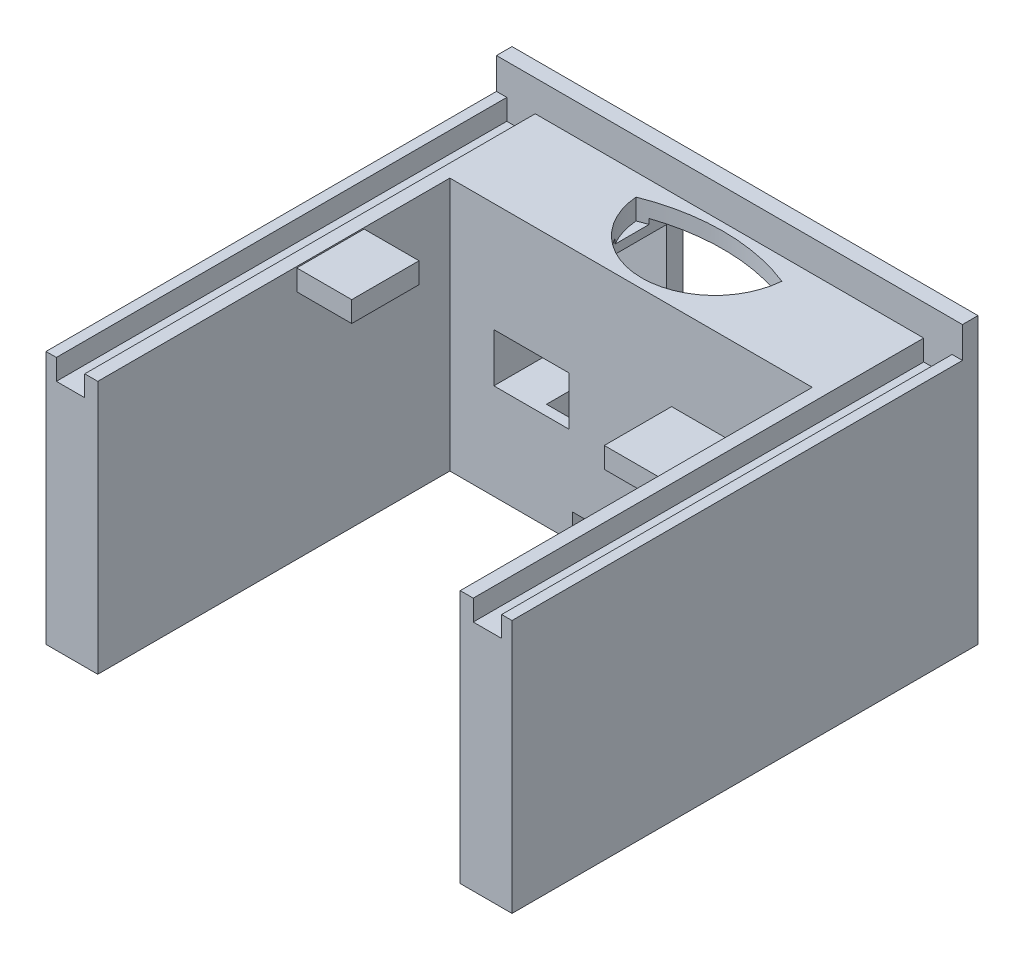
from build123d import *

# Parameters (mm, degrees)
BOSS_EXTRUDE1_DEPTH = 10
SKETCH2_R           = 40.5
CUT_EXTRUDE1_DEPTH  = 5
SKETCH4_R           = 2.15
CUT_EXTRUDE2_DEPTH  = 2
SKETCH5_R           = 15
CUT_EXTRUDE3_DEPTH  = 64.835726674
CUT_EXTRUDE4_DEPTH  = 66
SKETCH8_W           = 90
SKETCH8_H           = 90
BOSS_EXTRUDE2_DEPTH = 45
SKETCH9_W           = 70
SKETCH9_H           = 49
CUT_EXTRUDE5_DEPTH  = 68
CUT_EXTRUDE7_DEPTH  = 20
SKETCH12_W          = 0.314102564
SKETCH12_H          = 2.557692307
SKETCH12_H_2        = 3.589743589
SKETCH12_H_3        = 2.557692308
CUT_EXTRUDE9_DEPTH  = 4
CUT_EXTRUDE12_DEPTH = 3
SKETCH18_R          = 11.15
CUT_EXTRUDE13_DEPTH = 4.66
SKETCH20_W          = 13.66
SKETCH20_H          = 24.8
CUT_EXTRUDE14_DEPTH = 14.5
SKETCH22_R          = 1.45
BOSS_EXTRUDE3_DEPTH = 9
SKETCH24_W          = 13.66
SKETCH24_H          = 24.8
SKETCH24_R          = 1.45
CUT_EXTRUDE16_DEPTH = 14.5
CUT_EXTRUDE29_DEPTH = 10
SKETCH32_W          = 5.302834592
SKETCH32_H          = 4.66
CUT_EXTRUDE21_DEPTH = 10
SKETCH33_R          = 4
CUT_EXTRUDE22_DEPTH = 10
BOSS_EXTRUDE5_DEPTH = 10.61
SKETCH45_W          = 13
SKETCH45_H          = 4
BOSS_EXTRUDE6_DEPTH = 10.61
CUT_EXTRUDE31_DEPTH = 87


with BuildPart() as part:
    # Sketch1 → Boss-Extrude1 (new body)
    with BuildSketch(Plane(origin=(0, 0, 0), x_dir=(1, 0, 0), z_dir=(0, 1, 0))):
        Polygon((0, -45), (-45, -45), (-45, 45), (0, 45), (45, 45), (45, -45), align=None)
    extrude(amount=BOSS_EXTRUDE1_DEPTH)

    # Sketch2 → Cut-Extrude1 (cut)
    with BuildSketch(Plane(origin=(0, 10, 0), x_dir=(1, 0, 0), z_dir=(0, 1, 0))):
        Circle(SKETCH2_R)
    extrude(amount=-CUT_EXTRUDE1_DEPTH, mode=Mode.SUBTRACT)

    # Sketch4 → Cut-Extrude2 (cut)
    with BuildSketch(Plane(origin=(0, 5, 0), x_dir=(1, 0, 0), z_dir=(0, 1, 0))):
        with Locations((-20, 0)):
            Circle(SKETCH4_R)
        with Locations((20, 0)):
            Circle(SKETCH4_R)
    extrude(amount=-CUT_EXTRUDE2_DEPTH, mode=Mode.SUBTRACT)

    # Sketch5 → Cut-Extrude3 (cut, through all)
    with BuildSketch(Plane(origin=(0, 5, 0), x_dir=(1, 0, 0), z_dir=(0, 1, 0))):
        Circle(SKETCH5_R)
    extrude(amount=-CUT_EXTRUDE3_DEPTH, mode=Mode.SUBTRACT)

    # Sketch7 → Cut-Extrude4 (cut)
    with BuildSketch(Plane(origin=(0, 5, 0), x_dir=(1, 0, 0), z_dir=(0, 1, 0))):
        with BuildLine():
            ThreePointArc((-13.841521615, 37.800491998), (0.234545088, 24.817118498), (14.31061179, 37.800491998))
            ThreePointArc((14.31061179, 37.800491998), (0.234545088, 40.503688372), (-13.841521615, 37.800491998))
        make_face()
    extrude(amount=-CUT_EXTRUDE4_DEPTH, mode=Mode.SUBTRACT)

    # Sketch8 → Boss-Extrude2 (add)
    with BuildSketch(Plane.XZ):
        Rectangle(SKETCH8_W, SKETCH8_H)
    extrude(amount=BOSS_EXTRUDE2_DEPTH)

    # Sketch9 → Cut-Extrude5 (cut)
    with BuildSketch(Plane.XY.offset(45)):
        with Locations((0, -20.5)):
            Rectangle(SKETCH9_W, SKETCH9_H)
    extrude(amount=-CUT_EXTRUDE5_DEPTH, mode=Mode.SUBTRACT)

    # Sketch10 → Cut-Extrude7 (cut)
    with BuildSketch(Plane(origin=(0, 0, -45), x_dir=(-1, 0, 0), z_dir=(0, 0, -1))):
        Polygon((-12, -21), (-12, -25), (-18, -25), (-18, -37), (18.337886809, -37), (18.337886809, -25), (12, -25), (12, 1), (-12, 1), (-12, -2), align=None)
    extrude(amount=-CUT_EXTRUDE7_DEPTH, mode=Mode.SUBTRACT)

    # Sketch12 → Cut-Extrude9 (cut)
    # profile 1 of 28: a face of its own
    with BuildSketch(Plane(origin=(0, 0, -45), x_dir=(-1, 0, 0), z_dir=(0, 0, -1))):
        with BuildLine():
            Line((-40.511383242, -5.92052213), (-39.824985005, -5.92052213))
            add(Edge.make_bspline(
                [(-39.824985005, -5.92052213), (-39.777774098, -5.920574027), (-39.687315906, -5.920673462), (-39.55760085, -5.923688208), (-39.439791118, -5.9277149), (-39.334140737, -5.933296793), (-39.240324639, -5.939893384), (-39.15876734, -5.949145423), (-39.088827783, -5.958805719), (-39.046921334, -5.968627125), (-39.027809524, -5.973106265)],
                knots=[0, 0, 0, 0, 1.415646017, 2.712440637, 3.8905458, 4.950247383, 5.884950622, 6.709939814, 7.411656543, 8, 8, 8, 8], degree=3))
            add(Edge.make_bspline(
                [(-39.027809524, -5.973106265), (-39.00361599, -5.979728215), (-38.955799013, -5.992816077), (-38.88689797, -6.0190298), (-38.821344124, -6.050111965), (-38.758912566, -6.085535905), (-38.700370483, -6.126821469), (-38.644844442, -6.172295087), (-38.592824461, -6.223006656), (-38.54460307, -6.278387395), (-38.500318272, -6.337507605), (-38.462188589, -6.401249835), (-38.430261362, -6.468541139), (-38.402878091, -6.53933471), (-38.383169636, -6.614225033), (-38.368322737, -6.692691746), (-38.358899109, -6.774726436), (-38.357996547, -6.830786303), (-38.357537088, -6.859324214)],
                knots=[0, 0, 0, 0, 0.999701418, 1.975846123, 2.934577507, 3.890451536, 4.834027766, 5.787354733, 6.749476667, 7.726910423, 8.712836071, 9.690891519, 10.682875813, 11.679750201, 12.712814741, 13.765529915, 14.8625177, 16, 16, 16, 16], degree=3))
            add(Edge.make_bspline(
                [(-38.357537088, -6.859324214), (-38.357958513, -6.888101991), (-38.358783059, -6.944407655), (-38.368679344, -7.026780443), (-38.382009536, -7.105498833), (-38.402506588, -7.180388283), (-38.429352261, -7.251004054), (-38.460844314, -7.318425286), (-38.498827844, -7.381504958), (-38.542472674, -7.440472075), (-38.591024268, -7.495381988), (-38.644277206, -7.545836782), (-38.702016499, -7.59154112), (-38.764058647, -7.632597464), (-38.831008496, -7.668053744), (-38.901850649, -7.699811049), (-38.977200866, -7.726482109), (-39.02934338, -7.740512171), (-39.055854396, -7.747645528)],
                knots=[0, 0, 0, 0, 1.121902311, 2.195077645, 3.232258892, 4.234102512, 5.217864754, 6.176164875, 7.132989551, 8.084763148, 9.034132444, 9.988522005, 10.94243251, 11.903244335, 12.886203696, 13.894208494, 14.929344452, 16, 16, 16, 16], degree=3))
            add(Edge.make_bspline(
                [(-39.055854396, -7.747645528), (-39.07778173, -7.752308509), (-39.125836757, -7.762527703), (-39.204979479, -7.77393616), (-39.297124865, -7.783673761), (-39.402147145, -7.790974898), (-39.51995205, -7.797225267), (-39.650603307, -7.802193361), (-39.794357384, -7.804923214), (-39.894628628, -7.805064007), (-39.946980197, -7.805137515)],
                knots=[0, 0, 0, 0, 0.601384939, 1.31797006, 2.144135048, 3.087295005, 4.142315834, 5.309527816, 6.595305764, 8, 8, 8, 8], degree=3))
            Line((-39.946980197, -7.805137515), (-40.197280678, -7.805137515))
            Line((-40.197280678, -7.805137515), (-40.197280678, -9.42052213))
            Line((-40.197280678, -9.42052213), (-40.511383242, -9.42052213))
            Line((-40.511383242, -9.42052213), (-40.511383242, -5.92052213))
        make_face()
        with BuildLine():
            Line((-40.197280678, -6.279496489), (-40.197280678, -7.446163156))
            Line((-40.197280678, -7.446163156), (-39.584500229, -7.453875496))
            add(Edge.make_bspline(
                [(-39.584500229, -7.453875496), (-39.554580303, -7.453890959), (-39.496820503, -7.453920812), (-39.41338428, -7.449935588), (-39.335974993, -7.445335055), (-39.264830417, -7.438599132), (-39.199918483, -7.429077875), (-39.141130954, -7.419466137), (-39.088923671, -7.405560774), (-39.027824469, -7.386837705), (-38.959741122, -7.354905089), (-38.885673573, -7.308555199), (-38.822902987, -7.249474491), (-38.76858469, -7.18304666), (-38.725478812, -7.10914753), (-38.69392282, -7.030078593), (-38.675381663, -6.946650744), (-38.672895469, -6.889562605), (-38.671639652, -6.860726457)],
                knots=[0, 0, 0, 0, 1.160613943, 2.240541288, 3.23993089, 4.169200891, 5.011653406, 5.7853311, 6.478053781, 7.106038997, 8.262395093, 9.384106736, 10.481365981, 11.59014053, 12.70357646, 13.786202915, 14.881775077, 16, 16, 16, 16], degree=3))
            add(Edge.make_bspline(
                [(-38.671639652, -6.860726457), (-38.672902299, -6.832587944), (-38.675412283, -6.776652062), (-38.694068147, -6.694673301), (-38.725417461, -6.616437597), (-38.768874055, -6.543464511), (-38.821615185, -6.477275707), (-38.882914528, -6.41977858), (-38.952627789, -6.373556878), (-39.01747602, -6.343723596), (-39.075077206, -6.325508321), (-39.125109166, -6.31276348), (-39.181599841, -6.302587874), (-39.24456762, -6.294348371), (-39.313524454, -6.28729491), (-39.389062769, -6.282508933), (-39.470896412, -6.279707476), (-39.527706983, -6.279568521), (-39.557156479, -6.279496489)],
                knots=[0, 0, 0, 0, 1.120700087, 2.227813068, 3.331159281, 4.466773991, 5.599788987, 6.693661531, 7.80175334, 8.91857717, 9.525282508, 10.207424825, 10.974604443, 11.810962634, 12.737642355, 13.736264703, 14.826523623, 16, 16, 16, 16], degree=3))
            Line((-39.557156479, -6.279496489), (-40.197280678, -6.279496489))
        make_face(mode=Mode.SUBTRACT)
    # profile 2 of 28: a face of its own
    with BuildSketch(Plane(origin=(0, 0, -45), x_dir=(-1, 0, 0), z_dir=(0, 0, -1))):
        with BuildLine():
            Line((-37.819075549, -6.862829823), (-37.504972985, -6.862829823))
            Line((-37.504972985, -6.862829823), (-37.504972985, -7.239332227))
            add(Edge.make_bspline(
                [(-37.504972985, -7.239332227), (-37.481784227, -7.204276398), (-37.437435906, -7.137232399), (-37.363722976, -7.048563098), (-37.288219645, -6.975148051), (-37.210564458, -6.916644533), (-37.130186358, -6.872831414), (-37.048849406, -6.840738379), (-36.965273936, -6.821761064), (-36.909112012, -6.819227405), (-36.880974588, -6.817958028)],
                knots=[0, 0, 0, 0, 1.2804753, 2.448899062, 3.506932113, 4.484331642, 5.4025378, 6.288909075, 7.142734305, 8, 8, 8, 8], degree=3))
            add(Edge.make_bspline(
                [(-36.880974588, -6.817958028), (-36.859148261, -6.819148555), (-36.814239176, -6.82159814), (-36.746256586, -6.838808965), (-36.676213135, -6.866286988), (-36.631070747, -6.89212721), (-36.607537088, -6.905598252)],
                knots=[0, 0, 0, 0, 0.901110191, 1.854092781, 2.881294221, 4, 4, 4, 4], degree=3))
            Line((-36.607537088, -6.905598252), (-36.780013049, -7.177633509))
            add(Edge.make_bspline(
                [(-36.780013049, -7.177633509), (-36.795122071, -7.170893243), (-36.823801885, -7.158098927), (-36.865756451, -7.142956917), (-36.904437788, -7.134041001), (-36.929081346, -7.132690284), (-36.94056994, -7.132060592)],
                knots=[0, 0, 0, 0, 1.180555205, 2.24091978, 3.179933427, 4, 4, 4, 4], degree=3))
            add(Edge.make_bspline(
                [(-36.94056994, -7.132060592), (-36.965775674, -7.133740629), (-37.017188064, -7.137167419), (-37.092672563, -7.164106226), (-37.165919769, -7.207631467), (-37.224091431, -7.255902578), (-37.269133684, -7.302450376), (-37.30127391, -7.343098778), (-37.330756657, -7.38867741), (-37.358926877, -7.438407094), (-37.384593171, -7.49313694), (-37.40854784, -7.552320153), (-37.430206703, -7.616025282), (-37.442556948, -7.660407802), (-37.448883242, -7.683142323)],
                knots=[0, 0, 0, 0, 1.125678352, 2.296057538, 3.5422874, 4.923748041, 5.663163013, 6.437101912, 7.23742474, 8.08941207, 8.991984279, 9.93940061, 10.944477711, 12, 12, 12, 12], degree=3))
            add(Edge.make_bspline(
                [(-37.448883242, -7.683142323), (-37.453615635, -7.703419496), (-37.464097527, -7.748331895), (-37.474289065, -7.82368042), (-37.484358583, -7.912704078), (-37.491455201, -8.015650671), (-37.498033243, -8.132263115), (-37.501743325, -8.262719061), (-37.504846466, -8.407152412), (-37.504929533, -8.508126765), (-37.504972985, -8.56094681)],
                knots=[0, 0, 0, 0, 0.566838948, 1.255505196, 2.06880316, 3.007127437, 4.065329342, 5.249902469, 6.561414163, 8, 8, 8, 8], degree=3))
            Line((-37.504972985, -8.56094681), (-37.504972985, -9.42052213))
            Line((-37.504972985, -9.42052213), (-37.819075549, -9.42052213))
            Line((-37.819075549, -9.42052213), (-37.819075549, -6.862829823))
        make_face()
    # profile 3 of 28: a face of its own
    with BuildSketch(Plane(origin=(0, 0, -45), x_dir=(-1, 0, 0), z_dir=(0, 0, -1))):
        with BuildLine():
            add(Edge.make_bspline(
                [(-35.058057921, -6.817958028), (-35.010066648, -6.818979919), (-34.915967491, -6.820983598), (-34.778159605, -6.842398563), (-34.646614469, -6.875145928), (-34.520828277, -6.92041749), (-34.402411981, -6.98109944), (-34.289640737, -7.053508732), (-34.182823728, -7.139291325), (-34.118800699, -7.205649394), (-34.086303114, -7.239332227)],
                knots=[0, 0, 0, 0, 1.054011418, 2.066658804, 3.057071809, 4.030435133, 4.997543892, 5.974964718, 6.972108034, 8, 8, 8, 8], degree=3))
            add(Edge.make_bspline(
                [(-34.086303114, -7.239332227), (-34.058321159, -7.271546212), (-34.002898779, -7.335350755), (-33.93183306, -7.438806368), (-33.8706115, -7.545946468), (-33.821548539, -7.658193795), (-33.782863516, -7.774568466), (-33.755397819, -7.895470477), (-33.739060884, -8.020632824), (-33.736857918, -8.105636662), (-33.735742216, -8.148687195)],
                knots=[0, 0, 0, 0, 1.025258237, 2.030674902, 3.01204498, 3.988269485, 4.97094183, 5.956517959, 6.965070386, 8, 8, 8, 8], degree=3))
            add(Edge.make_bspline(
                [(-33.735742216, -8.148687195), (-33.736723553, -8.191987252), (-33.738662722, -8.277550186), (-33.757006338, -8.403569551), (-33.785537424, -8.525764374), (-33.826369262, -8.643623068), (-33.878727371, -8.757505895), (-33.942618059, -8.866915445), (-34.018489676, -8.972067578), (-34.104493673, -9.072069416), (-34.199545549, -9.164235631), (-34.302661697, -9.2445639), (-34.411815731, -9.313385425), (-34.528459084, -9.36882184), (-34.651526571, -9.412531541), (-34.781283639, -9.443231557), (-34.91752871, -9.461793241), (-35.010555931, -9.464176814), (-35.058057921, -9.465393925)],
                knots=[0, 0, 0, 0, 0.998656419, 1.973391657, 2.932242238, 3.890759089, 4.846373663, 5.82037756, 6.809684879, 7.83454468, 8.860553229, 9.859544525, 10.845671541, 11.83227036, 12.833544569, 13.85385346, 14.904124723, 16, 16, 16, 16], degree=3))
            add(Edge.make_bspline(
                [(-35.058057921, -9.465393925), (-35.105792641, -9.464172729), (-35.1992835, -9.461780955), (-35.336009482, -9.443303672), (-35.465999101, -9.412545689), (-35.5892277, -9.368678197), (-35.706372547, -9.313383653), (-35.816159044, -9.244771963), (-35.919358959, -9.164211808), (-36.014430944, -9.072075871), (-36.100429549, -8.972065915), (-36.176302557, -8.866915876), (-36.240192884, -8.757505783), (-36.292551087, -8.643623098), (-36.3333829, -8.525764366), (-36.361913993, -8.403569554), (-36.380257608, -8.277550185), (-36.382196776, -8.191987252), (-36.383178114, -8.148687195)],
                knots=[0, 0, 0, 0, 1.099876186, 2.154163076, 3.173186993, 4.173200201, 5.163417411, 6.152872554, 7.150605724, 8.17532212, 9.198891216, 10.186952605, 11.159729845, 12.11414092, 13.071450619, 14.029093627, 15.002601286, 16, 16, 16, 16], degree=3))
            add(Edge.make_bspline(
                [(-36.383178114, -8.148687195), (-36.382054803, -8.105870649), (-36.379830842, -8.021101246), (-36.363510333, -7.896174186), (-36.336151776, -7.775476797), (-36.29742038, -7.659551321), (-36.247905189, -7.547795885), (-36.187543901, -7.440391054), (-36.115753268, -7.337403253), (-36.060551317, -7.273681173), (-36.032617216, -7.241435592)],
                knots=[0, 0, 0, 0, 1.031353054, 2.041901799, 3.029428768, 4.008703097, 4.981709435, 5.96992636, 6.972712378, 8, 8, 8, 8], degree=3))
            add(Edge.make_bspline(
                [(-36.032617216, -7.241435592), (-36.000168625, -7.207460653), (-35.936352761, -7.140642957), (-35.829004034, -7.055110432), (-35.716510212, -6.981194359), (-35.596785286, -6.921718143), (-35.471102428, -6.874879625), (-35.338883186, -6.84231411), (-35.20060767, -6.821060755), (-35.106048049, -6.819002578), (-35.058057921, -6.817958028)],
                knots=[0, 0, 0, 0, 1.027980169, 2.021703884, 2.998553061, 3.971491411, 4.943284454, 5.930300938, 6.949603206, 8, 8, 8, 8], degree=3))
        make_face()
        with BuildLine():
            add(Edge.make_bspline(
                [(-35.059460165, -7.132060592), (-35.093397776, -7.133025184), (-35.160396905, -7.134929466), (-35.25901649, -7.149413371), (-35.353956643, -7.172360875), (-35.445397488, -7.204964931), (-35.53303066, -7.24706383), (-35.616940062, -7.29877219), (-35.697372502, -7.359405147), (-35.772754566, -7.428867818), (-35.841936878, -7.504746813), (-35.902414854, -7.585595172), (-35.953839961, -7.670101518), (-35.99668012, -7.758353729), (-36.028587308, -7.851246143), (-36.05176033, -7.947726774), (-36.066230571, -8.047992191), (-36.068116949, -8.116153209), (-36.069075549, -8.15079056)],
                knots=[0, 0, 0, 0, 1.021534396, 2.016698045, 2.994645724, 3.958388632, 4.93408049, 5.916473867, 6.921342795, 7.962252576, 8.998418191, 10.008913653, 10.997312074, 11.973003931, 12.956656626, 13.948281152, 14.957379055, 16, 16, 16, 16], degree=3))
            add(Edge.make_bspline(
                [(-36.069075549, -8.15079056), (-36.067468726, -8.195542587), (-36.064279481, -8.284366993), (-36.038344245, -8.415178115), (-35.994957965, -8.540759967), (-35.936370685, -8.660376353), (-35.862964467, -8.771048631), (-35.7764774, -8.869720116), (-35.6778377, -8.954905927), (-35.568221199, -9.025586773), (-35.449866882, -9.081746529), (-35.32461056, -9.121545504), (-35.193969866, -9.147417197), (-35.104689135, -9.149988671), (-35.059460165, -9.151291361)],
                knots=[0, 0, 0, 0, 1.016792936, 2.018143844, 3.017858371, 4.030088057, 5.03801393, 6.028138512, 7.003788237, 7.991172063, 8.984598303, 9.972568034, 10.972917682, 12, 12, 12, 12], degree=3))
            add(Edge.make_bspline(
                [(-35.059460165, -9.151291361), (-35.014233796, -9.149981081), (-34.9249582, -9.147394624), (-34.794499023, -9.121675804), (-34.669585051, -9.081572144), (-34.551353664, -9.025649934), (-34.44178706, -8.954637519), (-34.342437939, -8.870201142), (-34.256689328, -8.770787291), (-34.183355723, -8.660229762), (-34.12380898, -8.54094541), (-34.080625778, -8.415154937), (-34.054628193, -8.284372895), (-34.051447364, -8.195544565), (-34.04984478, -8.15079056)],
                knots=[0, 0, 0, 0, 1.02726834, 2.027799167, 3.010890988, 4.004497153, 4.992059811, 5.971914811, 6.958719428, 7.966827853, 8.981595046, 9.981490638, 10.983022906, 12, 12, 12, 12], degree=3))
            add(Edge.make_bspline(
                [(-34.04984478, -8.15079056), (-34.05080305, -8.116153002), (-34.052688779, -8.047991577), (-34.067163744, -7.947729123), (-34.090319283, -7.851237526), (-34.122290901, -7.758385523), (-34.164944915, -7.669873019), (-34.217361708, -7.585843292), (-34.277592733, -7.504466746), (-34.347609854, -7.429113105), (-34.422913232, -7.359378068), (-34.50337827, -7.298748679), (-34.587163249, -7.247291083), (-34.674541831, -7.204604843), (-34.765994399, -7.172657503), (-34.860801528, -7.149280871), (-34.959000338, -7.134990674), (-35.025759381, -7.133043533), (-35.059460165, -7.132060592)],
                knots=[0, 0, 0, 0, 1.042956736, 2.052379634, 3.044323526, 4.02829302, 5.004299113, 5.996692471, 7.007513377, 8.048758398, 9.090003419, 10.095195979, 11.07790575, 12.047570684, 13.018257071, 13.989683339, 14.985167495, 16, 16, 16, 16], degree=3))
        make_face(mode=Mode.SUBTRACT)
    # profile 4 of 28: a face of its own
    with BuildSketch(Plane(origin=(0, 0, -45), x_dir=(-1, 0, 0), z_dir=(0, 0, -1))):
        Polygon((-32.793434524, -5.830778541), (-32.47933196, -5.830778541), (-32.47933196, -6.862829823), (-32.030614011, -6.862829823), (-32.030614011, -7.176932387), (-32.47933196, -7.176932387), (-32.47933196, -9.42052213), (-32.793434524, -9.42052213), (-32.793434524, -7.176932387), (-33.242152473, -7.176932387), (-33.242152473, -6.862829823), (-32.793434524, -6.862829823), align=None)
    # profile 5 of 28: a face of its own
    with BuildSketch(Plane(origin=(0, 0, -45), x_dir=(-1, 0, 0), z_dir=(0, 0, -1))):
        with BuildLine():
            add(Edge.make_bspline(
                [(-30.25677587, -6.817958028), (-30.208784597, -6.818979919), (-30.11468544, -6.820983598), (-29.976877554, -6.842398563), (-29.845332418, -6.875145928), (-29.719546226, -6.92041749), (-29.60112993, -6.98109944), (-29.488358686, -7.053508732), (-29.381541677, -7.139291325), (-29.317518648, -7.205649394), (-29.285021062, -7.239332227)],
                knots=[0, 0, 0, 0, 1.054011418, 2.066658804, 3.057071809, 4.030435133, 4.997543892, 5.974964718, 6.972108034, 8, 8, 8, 8], degree=3))
            add(Edge.make_bspline(
                [(-29.285021062, -7.239332227), (-29.257039108, -7.271546212), (-29.201616728, -7.335350755), (-29.130551009, -7.438806368), (-29.069329449, -7.545946468), (-29.020266488, -7.658193795), (-28.981581464, -7.774568466), (-28.954115768, -7.895470477), (-28.937778833, -8.020632824), (-28.935575866, -8.105636662), (-28.934460165, -8.148687195)],
                knots=[0, 0, 0, 0, 1.025258237, 2.030674902, 3.01204498, 3.988269485, 4.97094183, 5.956517959, 6.965070386, 8, 8, 8, 8], degree=3))
            add(Edge.make_bspline(
                [(-28.934460165, -8.148687195), (-28.935441502, -8.191987252), (-28.93738067, -8.277550186), (-28.955724287, -8.403569551), (-28.984255373, -8.525764374), (-29.025087211, -8.643623068), (-29.07744532, -8.757505895), (-29.141336008, -8.866915445), (-29.217207625, -8.972067578), (-29.303211622, -9.072069416), (-29.398263498, -9.164235631), (-29.501379646, -9.2445639), (-29.61053368, -9.313385425), (-29.727177033, -9.36882184), (-29.85024452, -9.412531541), (-29.980001588, -9.443231557), (-30.116246658, -9.461793241), (-30.20927388, -9.464176814), (-30.25677587, -9.465393925)],
                knots=[0, 0, 0, 0, 0.998656419, 1.973391657, 2.932242238, 3.890759089, 4.846373663, 5.82037756, 6.809684879, 7.83454468, 8.860553229, 9.859544525, 10.845671541, 11.83227036, 12.833544569, 13.85385346, 14.904124723, 16, 16, 16, 16], degree=3))
            add(Edge.make_bspline(
                [(-30.25677587, -9.465393925), (-30.304510589, -9.464172729), (-30.398001449, -9.461780955), (-30.534727431, -9.443303672), (-30.66471705, -9.412545689), (-30.787945649, -9.368678197), (-30.905090496, -9.313383653), (-31.014876992, -9.244771963), (-31.118076908, -9.164211808), (-31.213148892, -9.072075871), (-31.299147498, -8.972065915), (-31.375020506, -8.866915876), (-31.438910832, -8.757505783), (-31.491269036, -8.643623098), (-31.532100849, -8.525764366), (-31.560631942, -8.403569554), (-31.578975556, -8.277550185), (-31.580914725, -8.191987252), (-31.581896062, -8.148687195)],
                knots=[0, 0, 0, 0, 1.099876186, 2.154163076, 3.173186993, 4.173200201, 5.163417411, 6.152872554, 7.150605724, 8.17532212, 9.198891216, 10.186952605, 11.159729845, 12.11414092, 13.071450619, 14.029093627, 15.002601286, 16, 16, 16, 16], degree=3))
            add(Edge.make_bspline(
                [(-31.581896062, -8.148687195), (-31.580772752, -8.105870649), (-31.57854879, -8.021101246), (-31.562228281, -7.896174186), (-31.534869725, -7.775476797), (-31.496138328, -7.659551321), (-31.446623138, -7.547795885), (-31.38626185, -7.440391054), (-31.314471217, -7.337403253), (-31.259269266, -7.273681173), (-31.231335165, -7.241435592)],
                knots=[0, 0, 0, 0, 1.031353054, 2.041901799, 3.029428768, 4.008703097, 4.981709435, 5.96992636, 6.972712378, 8, 8, 8, 8], degree=3))
            add(Edge.make_bspline(
                [(-31.231335165, -7.241435592), (-31.198886574, -7.207460653), (-31.13507071, -7.140642957), (-31.027721982, -7.055110432), (-30.915228161, -6.981194359), (-30.795503235, -6.921718143), (-30.669820377, -6.874879625), (-30.537601135, -6.84231411), (-30.399325619, -6.821060755), (-30.304765998, -6.819002578), (-30.25677587, -6.817958028)],
                knots=[0, 0, 0, 0, 1.027980169, 2.021703884, 2.998553061, 3.971491411, 4.943284454, 5.930300938, 6.949603206, 8, 8, 8, 8], degree=3))
        make_face()
        with BuildLine():
            add(Edge.make_bspline(
                [(-30.258178114, -7.132060592), (-30.292115725, -7.133025184), (-30.359114854, -7.134929466), (-30.457734438, -7.149413371), (-30.552674592, -7.172360875), (-30.644115436, -7.204964931), (-30.731748609, -7.24706383), (-30.815658011, -7.29877219), (-30.896090451, -7.359405147), (-30.971472514, -7.428867818), (-31.040654827, -7.504746813), (-31.101132803, -7.585595172), (-31.15255791, -7.670101518), (-31.195398068, -7.758353729), (-31.227305257, -7.851246143), (-31.250478279, -7.947726774), (-31.26494852, -8.047992191), (-31.266834898, -8.116153209), (-31.267793498, -8.15079056)],
                knots=[0, 0, 0, 0, 1.021534396, 2.016698045, 2.994645724, 3.958388632, 4.93408049, 5.916473867, 6.921342795, 7.962252576, 8.998418191, 10.008913653, 10.997312074, 11.973003931, 12.956656626, 13.948281152, 14.957379055, 16, 16, 16, 16], degree=3))
            add(Edge.make_bspline(
                [(-31.267793498, -8.15079056), (-31.266186675, -8.195542587), (-31.26299743, -8.284366993), (-31.237062194, -8.415178115), (-31.193675914, -8.540759967), (-31.135088634, -8.660376353), (-31.061682415, -8.771048631), (-30.975195349, -8.869720116), (-30.876555648, -8.954905927), (-30.766939148, -9.025586773), (-30.64858483, -9.081746529), (-30.523328509, -9.121545504), (-30.392687815, -9.147417197), (-30.303407084, -9.149988671), (-30.258178114, -9.151291361)],
                knots=[0, 0, 0, 0, 1.016792936, 2.018143844, 3.017858371, 4.030088057, 5.03801393, 6.028138512, 7.003788237, 7.991172063, 8.984598303, 9.972568034, 10.972917682, 12, 12, 12, 12], degree=3))
            add(Edge.make_bspline(
                [(-30.258178114, -9.151291361), (-30.212951745, -9.149981081), (-30.123676149, -9.147394624), (-29.993216972, -9.121675804), (-29.868303, -9.081572144), (-29.750071612, -9.025649934), (-29.640505009, -8.954637519), (-29.541155888, -8.870201142), (-29.455407277, -8.770787291), (-29.382073672, -8.660229762), (-29.322526929, -8.54094541), (-29.279343727, -8.415154937), (-29.253346141, -8.284372895), (-29.250165313, -8.195544565), (-29.248562729, -8.15079056)],
                knots=[0, 0, 0, 0, 1.02726834, 2.027799167, 3.010890988, 4.004497153, 4.992059811, 5.971914811, 6.958719428, 7.966827853, 8.981595046, 9.981490638, 10.983022906, 12, 12, 12, 12], degree=3))
            add(Edge.make_bspline(
                [(-29.248562729, -8.15079056), (-29.249520999, -8.116153002), (-29.251406728, -8.047991577), (-29.265881692, -7.947729123), (-29.289037232, -7.851237526), (-29.321008849, -7.758385523), (-29.363662863, -7.669873019), (-29.416079656, -7.585843292), (-29.476310682, -7.504466746), (-29.546327803, -7.429113105), (-29.621631181, -7.359378068), (-29.702096219, -7.298748679), (-29.785881197, -7.247291083), (-29.87325978, -7.204604843), (-29.964712348, -7.172657503), (-30.059519477, -7.149280871), (-30.157718287, -7.134990674), (-30.22447733, -7.133043533), (-30.258178114, -7.132060592)],
                knots=[0, 0, 0, 0, 1.042956736, 2.052379634, 3.044323526, 4.02829302, 5.004299113, 5.996692471, 7.007513377, 8.048758398, 9.090003419, 10.095195979, 11.07790575, 12.047570684, 13.018257071, 13.989683339, 14.985167495, 16, 16, 16, 16], degree=3))
        make_face(mode=Mode.SUBTRACT)
    # profile 6 of 28: a face of its own
    with BuildSketch(Plane(origin=(0, 0, -45), x_dir=(-1, 0, 0), z_dir=(0, 0, -1))):
        with BuildLine():
            Line((-28.216511447, -5.92052213), (-27.53011321, -5.92052213))
            add(Edge.make_bspline(
                [(-27.53011321, -5.92052213), (-27.482902304, -5.920574027), (-27.392444111, -5.920673462), (-27.262729055, -5.923688208), (-27.144919323, -5.9277149), (-27.039268942, -5.933296793), (-26.945452844, -5.939893384), (-26.863895545, -5.949145423), (-26.793955989, -5.958805719), (-26.752049539, -5.968627125), (-26.732937729, -5.973106265)],
                knots=[0, 0, 0, 0, 1.415646017, 2.712440637, 3.8905458, 4.950247383, 5.884950622, 6.709939814, 7.411656543, 8, 8, 8, 8], degree=3))
            add(Edge.make_bspline(
                [(-26.732937729, -5.973106265), (-26.708744195, -5.979728215), (-26.660927218, -5.992816077), (-26.592026175, -6.0190298), (-26.526472329, -6.050111965), (-26.464040771, -6.085535905), (-26.405498688, -6.126821469), (-26.349972647, -6.172295087), (-26.297952667, -6.223006656), (-26.249731275, -6.278387395), (-26.205446477, -6.337507605), (-26.167316794, -6.401249835), (-26.135389567, -6.468541139), (-26.108006296, -6.53933471), (-26.088297841, -6.614225033), (-26.073450942, -6.692691746), (-26.064027314, -6.774726436), (-26.063124752, -6.830786303), (-26.062665293, -6.859324214)],
                knots=[0, 0, 0, 0, 0.999701418, 1.975846123, 2.934577507, 3.890451536, 4.834027766, 5.787354733, 6.749476667, 7.726910423, 8.712836071, 9.690891519, 10.682875813, 11.679750201, 12.712814741, 13.765529915, 14.8625177, 16, 16, 16, 16], degree=3))
            add(Edge.make_bspline(
                [(-26.062665293, -6.859324214), (-26.063086718, -6.888101991), (-26.063911264, -6.944407655), (-26.073807549, -7.026780443), (-26.087137741, -7.105498833), (-26.107634793, -7.180388283), (-26.134480466, -7.251004054), (-26.165972519, -7.318425286), (-26.203956049, -7.381504958), (-26.247600879, -7.440472075), (-26.296152473, -7.495381988), (-26.349405412, -7.545836782), (-26.407144704, -7.59154112), (-26.469186852, -7.632597464), (-26.536136701, -7.668053744), (-26.606978855, -7.699811049), (-26.682329071, -7.726482109), (-26.734471585, -7.740512171), (-26.760982601, -7.747645528)],
                knots=[0, 0, 0, 0, 1.121902311, 2.195077645, 3.232258892, 4.234102512, 5.217864754, 6.176164875, 7.132989551, 8.084763148, 9.034132444, 9.988522005, 10.94243251, 11.903244335, 12.886203696, 13.894208494, 14.929344452, 16, 16, 16, 16], degree=3))
            add(Edge.make_bspline(
                [(-26.760982601, -7.747645528), (-26.782909935, -7.752308509), (-26.830964962, -7.762527703), (-26.910107684, -7.77393616), (-27.00225307, -7.783673761), (-27.10727535, -7.790974898), (-27.225080255, -7.797225267), (-27.355731512, -7.802193361), (-27.49948559, -7.804923214), (-27.599756834, -7.805064007), (-27.652108402, -7.805137515)],
                knots=[0, 0, 0, 0, 0.601384939, 1.31797006, 2.144135048, 3.087295005, 4.142315834, 5.309527816, 6.595305764, 8, 8, 8, 8], degree=3))
            Line((-27.652108402, -7.805137515), (-27.902408883, -7.805137515))
            Line((-27.902408883, -7.805137515), (-27.902408883, -9.42052213))
            Line((-27.902408883, -9.42052213), (-28.216511447, -9.42052213))
            Line((-28.216511447, -9.42052213), (-28.216511447, -5.92052213))
        make_face()
        with BuildLine():
            Line((-27.902408883, -6.279496489), (-27.902408883, -7.446163156))
            Line((-27.902408883, -7.446163156), (-27.289628434, -7.453875496))
            add(Edge.make_bspline(
                [(-27.289628434, -7.453875496), (-27.259708508, -7.453890959), (-27.201948708, -7.453920812), (-27.118512485, -7.449935588), (-27.041103198, -7.445335055), (-26.969958622, -7.438599132), (-26.905046688, -7.429077875), (-26.846259159, -7.419466137), (-26.794051876, -7.405560774), (-26.732952674, -7.386837705), (-26.664869327, -7.354905089), (-26.590801778, -7.308555199), (-26.528031192, -7.249474491), (-26.473712895, -7.18304666), (-26.430607017, -7.10914753), (-26.399051025, -7.030078593), (-26.380509868, -6.946650744), (-26.378023674, -6.889562605), (-26.376767857, -6.860726457)],
                knots=[0, 0, 0, 0, 1.160613943, 2.240541288, 3.23993089, 4.169200891, 5.011653406, 5.7853311, 6.478053781, 7.106038997, 8.262395093, 9.384106736, 10.481365981, 11.59014053, 12.70357646, 13.786202915, 14.881775077, 16, 16, 16, 16], degree=3))
            add(Edge.make_bspline(
                [(-26.376767857, -6.860726457), (-26.378030504, -6.832587944), (-26.380540489, -6.776652062), (-26.399196352, -6.694673301), (-26.430545666, -6.616437597), (-26.47400226, -6.543464511), (-26.52674339, -6.477275707), (-26.588042733, -6.41977858), (-26.657755995, -6.373556878), (-26.722604226, -6.343723596), (-26.780205412, -6.325508321), (-26.830237371, -6.31276348), (-26.886728046, -6.302587874), (-26.949695825, -6.294348371), (-27.018652659, -6.28729491), (-27.094190974, -6.282508933), (-27.176024618, -6.279707476), (-27.232835188, -6.279568521), (-27.262284684, -6.279496489)],
                knots=[0, 0, 0, 0, 1.120700087, 2.227813068, 3.331159281, 4.466773991, 5.599788987, 6.693661531, 7.80175334, 8.91857717, 9.525282508, 10.207424825, 10.974604443, 11.810962634, 12.737642355, 13.736264703, 14.826523623, 16, 16, 16, 16], degree=3))
            Line((-27.262284684, -6.279496489), (-27.902408883, -6.279496489))
        make_face(mode=Mode.SUBTRACT)
    # profile 7 of 28: a face of its own
    with BuildSketch(Plane(origin=(0, 0, -45), x_dir=(-1, 0, 0), z_dir=(0, 0, -1))):
        with BuildLine():
            add(Edge.make_bspline(
                [(-25.323682921, -5.785906746), (-25.304191605, -5.786810898), (-25.266023866, -5.788581402), (-25.210830598, -5.803742879), (-25.160573586, -5.829442565), (-25.115995853, -5.863922246), (-25.077743966, -5.904471689), (-25.050963256, -5.951732657), (-25.03375086, -6.002791296), (-25.031672305, -6.038406385), (-25.030614011, -6.056539759)],
                knots=[0, 0, 0, 0, 1.055194115, 2.066272739, 3.074728998, 4.095836921, 5.109056067, 6.073838105, 7.019297344, 8, 8, 8, 8], degree=3))
            add(Edge.make_bspline(
                [(-25.030614011, -6.056539759), (-25.031696171, -6.074202412), (-25.033835473, -6.109119387), (-25.050949961, -6.159292859), (-25.077972199, -6.205897142), (-25.115971324, -6.246367853), (-25.160580085, -6.280828473), (-25.210828871, -6.306533212), (-25.26602432, -6.321693349), (-25.304191759, -6.323464038), (-25.323682921, -6.324368284)],
                knots=[0, 0, 0, 0, 0.96129708, 1.900370562, 2.859976407, 3.87933698, 4.906634145, 5.921202961, 6.938410037, 8, 8, 8, 8], degree=3))
            add(Edge.make_bspline(
                [(-25.323682921, -6.324368284), (-25.342951196, -6.323498564), (-25.380454377, -6.321805767), (-25.434821219, -6.30623575), (-25.484649708, -6.280819676), (-25.529314381, -6.246593491), (-25.566544574, -6.205648594), (-25.5936429, -6.1593213), (-25.610717861, -6.109112146), (-25.61286249, -6.074199979), (-25.613947344, -6.056539759)],
                knots=[0, 0, 0, 0, 1.054934014, 2.053291228, 3.073705704, 4.106921865, 5.123545215, 6.088680038, 7.033164197, 8, 8, 8, 8], degree=3))
            add(Edge.make_bspline(
                [(-25.613947344, -6.056539759), (-25.612886258, -6.038408909), (-25.610802217, -6.002798776), (-25.593630101, -5.951703744), (-25.566770293, -5.904722242), (-25.529289729, -5.863696742), (-25.484656269, -5.829451308), (-25.434819524, -5.804040326), (-25.380454824, -5.788468987), (-25.342951348, -5.786776372), (-25.323682921, -5.785906746)],
                knots=[0, 0, 0, 0, 0.98631895, 1.937192651, 2.907499808, 3.917963147, 4.944918757, 5.95915025, 6.951458133, 8, 8, 8, 8], degree=3))
        make_face()
    # profile 8 of 28: a face of its own
    with BuildSketch(Plane(origin=(0, 0, -45), x_dir=(-1, 0, 0), z_dir=(0, 0, -1))):
        with Locations((-25.322280678, -8.141675977)):
            Rectangle(SKETCH12_W, SKETCH12_H)
    # profile 9 of 28: a face of its own
    with BuildSketch(Plane(origin=(0, 0, -45), x_dir=(-1, 0, 0), z_dir=(0, 0, -1))):
        with Locations((-24.290229396, -7.625650335)):
            Rectangle(SKETCH12_W, SKETCH12_H_2)
    # profile 10 of 28: a face of its own
    with BuildSketch(Plane(origin=(0, 0, -45), x_dir=(-1, 0, 0), z_dir=(0, 0, -1))):
        with Locations((-23.303049908, -7.625650335)):
            Rectangle(SKETCH12_W, SKETCH12_H_2)
    # profile 11 of 28: a face of its own
    with BuildSketch(Plane(origin=(0, 0, -45), x_dir=(-1, 0, 0), z_dir=(0, 0, -1))):
        with BuildLine():
            Line((-40.511383242, -16.253855464), (-40.511383242, -12.753855464))
            Line((-40.511383242, -12.753855464), (-39.804652473, -12.753855464))
            add(Edge.make_bspline(
                [(-39.804652473, -12.753855464), (-39.743183484, -12.754298034), (-39.624425719, -12.755153077), (-39.452813272, -12.760574468), (-39.294029509, -12.770164934), (-39.14859665, -12.78413446), (-39.016115438, -12.801287493), (-38.89695683, -12.822787898), (-38.790504687, -12.848176068), (-38.725035246, -12.869821518), (-38.694075549, -12.880057387)],
                knots=[0, 0, 0, 0, 1.314313732, 2.53924729, 3.670748893, 4.714932338, 5.66265055, 6.526160246, 7.303039223, 8, 8, 8, 8], degree=3))
            add(Edge.make_bspline(
                [(-38.694075549, -12.880057387), (-38.65358081, -12.895488093), (-38.573509618, -12.925999587), (-38.459502495, -12.983555888), (-38.352177132, -13.04876899), (-38.250957987, -13.121724852), (-38.158157161, -13.204489201), (-38.070149264, -13.293546286), (-37.990534541, -13.392134627), (-37.917626244, -13.498209615), (-37.851890585, -13.610521667), (-37.794751427, -13.728856776), (-37.747297434, -13.852613984), (-37.707904207, -13.981449132), (-37.67685775, -14.115645509), (-37.655675818, -14.255359376), (-37.641704828, -14.400038565), (-37.640300777, -14.498213029), (-37.63958837, -14.548026137)],
                knots=[0, 0, 0, 0, 0.984719456, 1.947108742, 2.898477687, 3.838006223, 4.779231079, 5.722358779, 6.681677486, 7.655904652, 8.64651281, 9.637519902, 10.640069247, 11.656948941, 12.698408672, 13.768548281, 14.867775369, 16, 16, 16, 16], degree=3))
            add(Edge.make_bspline(
                [(-37.63958837, -14.548026137), (-37.640217337, -14.591287375), (-37.641456784, -14.676538164), (-37.652586099, -14.80217906), (-37.668762419, -14.924092631), (-37.693806617, -15.041698331), (-37.724209131, -15.156026549), (-37.763173282, -15.265858794), (-37.807808778, -15.372202603), (-37.859858657, -15.473620079), (-37.917000042, -15.569703451), (-37.978321785, -15.660278979), (-38.04375848, -15.744054201), (-38.113934113, -15.821282813), (-38.18794183, -15.891848391), (-38.26626616, -15.956340407), (-38.349109211, -16.013496962), (-38.436099934, -16.06556407), (-38.529776063, -16.110984425), (-38.631911929, -16.149414435), (-38.742943107, -16.181261051), (-38.862597064, -16.207831946), (-38.991080542, -16.228909249), (-39.128519508, -16.243035641), (-39.274702797, -16.252588574), (-39.375082063, -16.253424968), (-39.426747825, -16.253855464)],
                knots=[0, 0, 0, 0, 1.105936401, 2.179363191, 3.223086493, 4.248585256, 5.251745608, 6.245858792, 7.225916811, 8.198733463, 9.158002045, 10.082870192, 10.993790845, 11.873723703, 12.748670949, 13.606408763, 14.465103618, 15.319838547, 16.196477973, 17.123216899, 18.106603292, 19.147568657, 20.255746949, 21.433717677, 22.679120308, 24, 24, 24, 24], degree=3))
            Line((-39.426747825, -16.253855464), (-40.511383242, -16.253855464))
        make_face()
        with BuildLine():
            Line((-40.197280678, -15.894881105), (-39.795537889, -15.894881105))
            add(Edge.make_bspline(
                [(-39.795537889, -15.894881105), (-39.737809518, -15.894633008), (-39.62677672, -15.894155828), (-39.467118723, -15.889968625), (-39.321239326, -15.883126688), (-39.189117817, -15.87355161), (-39.070828793, -15.860882995), (-38.966125043, -15.846758092), (-38.875349784, -15.829160641), (-38.820420347, -15.813209682), (-38.795037088, -15.805838637)],
                knots=[0, 0, 0, 0, 1.375205317, 2.645023457, 3.804390687, 4.853969522, 5.800190428, 6.637939096, 7.370582563, 8, 8, 8, 8], degree=3))
            add(Edge.make_bspline(
                [(-38.795037088, -15.805838637), (-38.763088726, -15.794587079), (-38.699955088, -15.772352705), (-38.609074002, -15.731795044), (-38.524316998, -15.683752974), (-38.444206973, -15.6303507), (-38.369880317, -15.569704698), (-38.300456201, -15.50313371), (-38.236074399, -15.430298935), (-38.177400091, -15.351290773), (-38.124891787, -15.266600977), (-38.079420558, -15.177062144), (-38.039569026, -15.083655333), (-38.008290434, -14.984946175), (-37.98377485, -14.881817116), (-37.966410162, -14.774260903), (-37.955595437, -14.662297621), (-37.954333989, -14.586145497), (-37.953690934, -14.547325015)],
                knots=[0, 0, 0, 0, 0.998632004, 1.973411704, 2.929992603, 3.868527914, 4.809262121, 5.754881198, 6.702106254, 7.672490631, 8.653608572, 9.636854334, 10.631411391, 11.644891563, 12.686317036, 13.754757253, 14.855430412, 16, 16, 16, 16], degree=3))
            add(Edge.make_bspline(
                [(-37.953690934, -14.547325015), (-37.954204221, -14.506391535), (-37.955212579, -14.42597735), (-37.967886889, -14.307986655), (-37.986408445, -14.194506005), (-38.013192131, -14.085527809), (-38.04732301, -13.980839457), (-38.089917652, -13.881019947), (-38.138584271, -13.785015078), (-38.196487608, -13.695040712), (-38.259903201, -13.609947603), (-38.33028108, -13.531992688), (-38.406503119, -13.460998387), (-38.487737968, -13.395859075), (-38.576275068, -13.339195399), (-38.670028758, -13.288508718), (-38.77037443, -13.245492826), (-38.840187125, -13.222613964), (-38.875666094, -13.210986874)],
                knots=[0, 0, 0, 0, 1.122418816, 2.205001699, 3.251619955, 4.274784885, 5.280384055, 6.268708349, 7.249350384, 8.229342522, 9.199999885, 10.157847722, 11.105861043, 12.055065948, 13.010012805, 13.98527497, 14.976112212, 16, 16, 16, 16], degree=3))
            add(Edge.make_bspline(
                [(-38.875666094, -13.210986874), (-38.905017241, -13.202870446), (-38.967425831, -13.185612694), (-39.069265295, -13.166787321), (-39.183880444, -13.150182822), (-39.311780146, -13.136124783), (-39.452818605, -13.126037461), (-39.607104293, -13.118466147), (-39.774703897, -13.113359514), (-39.890886431, -13.113010807), (-39.951186928, -13.112829823)],
                knots=[0, 0, 0, 0, 0.674548936, 1.434276114, 2.292660221, 3.240891867, 4.284742987, 5.42552168, 6.663806718, 8, 8, 8, 8], degree=3))
            Line((-39.951186928, -13.112829823), (-40.197280678, -13.112829823))
            Line((-40.197280678, -13.112829823), (-40.197280678, -15.894881105))
        make_face(mode=Mode.SUBTRACT)
    # profile 12 of 28: a face of its own
    with BuildSketch(Plane(origin=(0, 0, -45), x_dir=(-1, 0, 0), z_dir=(0, 0, -1))):
        with BuildLine():
            add(Edge.make_bspline(
                [(-36.900605998, -12.619240079), (-36.881114682, -12.620144232), (-36.842946943, -12.621914736), (-36.787753675, -12.637076213), (-36.737496663, -12.662775898), (-36.69291893, -12.697255579), (-36.654667043, -12.737805023), (-36.627886333, -12.785065991), (-36.610673937, -12.83612463), (-36.608595381, -12.871739719), (-36.607537088, -12.889873092)],
                knots=[0, 0, 0, 0, 1.055194115, 2.066272739, 3.074728998, 4.095836921, 5.109056067, 6.073838105, 7.019297344, 8, 8, 8, 8], degree=3))
            add(Edge.make_bspline(
                [(-36.607537088, -12.889873092), (-36.608619248, -12.907535745), (-36.61075855, -12.94245272), (-36.627873038, -12.992626192), (-36.654895276, -13.039230476), (-36.692894401, -13.079701186), (-36.737503162, -13.114161806), (-36.787751948, -13.139866545), (-36.842947397, -13.155026682), (-36.881114836, -13.156797371), (-36.900605998, -13.157701618)],
                knots=[0, 0, 0, 0, 0.96129708, 1.900370562, 2.859976407, 3.87933698, 4.906634145, 5.921202961, 6.938410037, 8, 8, 8, 8], degree=3))
            add(Edge.make_bspline(
                [(-36.900605998, -13.157701618), (-36.919874273, -13.156831897), (-36.957377454, -13.155139101), (-37.011744296, -13.139569083), (-37.061572785, -13.11415301), (-37.106237458, -13.079926825), (-37.143467651, -13.038981927), (-37.170565976, -12.992654634), (-37.187640938, -12.942445479), (-37.189785567, -12.907533313), (-37.190870421, -12.889873092)],
                knots=[0, 0, 0, 0, 1.054934014, 2.053291228, 3.073705704, 4.106921865, 5.123545215, 6.088680038, 7.033164197, 8, 8, 8, 8], degree=3))
            add(Edge.make_bspline(
                [(-37.190870421, -12.889873092), (-37.189809335, -12.871742242), (-37.187725294, -12.83613211), (-37.170553177, -12.785037077), (-37.14369337, -12.738055575), (-37.106212806, -12.697030076), (-37.061579346, -12.662784641), (-37.011742601, -12.637373659), (-36.957377901, -12.62180232), (-36.919874425, -12.620109706), (-36.900605998, -12.619240079)],
                knots=[0, 0, 0, 0, 0.98631895, 1.937192651, 2.907499808, 3.917963147, 4.944918757, 5.95915025, 6.951458133, 8, 8, 8, 8], degree=3))
        make_face()
    # profile 13 of 28: a face of its own
    with BuildSketch(Plane(origin=(0, 0, -45), x_dir=(-1, 0, 0), z_dir=(0, 0, -1))):
        with Locations((-36.899203755, -14.97500931)):
            Rectangle(SKETCH12_W, SKETCH12_H_3)
    # profile 14 of 28: a face of its own
    with BuildSketch(Plane(origin=(0, 0, -45), x_dir=(-1, 0, 0), z_dir=(0, 0, -1))):
        with BuildLine():
            Line((-34.767793498, -14.015173573), (-34.980934524, -14.234624695))
            add(Edge.make_bspline(
                [(-34.980934524, -14.234624695), (-34.999325027, -14.213311548), (-35.034779753, -14.172222311), (-35.091011234, -14.117285245), (-35.147034838, -14.071148306), (-35.202083651, -14.032196047), (-35.25754192, -14.0027469), (-35.312758838, -13.981252038), (-35.367791577, -13.967950233), (-35.404577612, -13.966235794), (-35.422641255, -13.965393925)],
                knots=[0, 0, 0, 0, 1.26578478, 2.440284043, 3.530471711, 4.527705817, 5.468200915, 6.346673037, 7.188140097, 8, 8, 8, 8], degree=3))
            add(Edge.make_bspline(
                [(-35.422641255, -13.965393925), (-35.444780644, -13.966468798), (-35.48834783, -13.968583996), (-35.550773649, -13.989697427), (-35.608724274, -14.022106165), (-35.658881254, -14.068074749), (-35.701368934, -14.120839017), (-35.732382615, -14.179835342), (-35.751348598, -14.243283386), (-35.75375333, -14.287313244), (-35.754972985, -14.309644727)],
                knots=[0, 0, 0, 0, 0.99966794, 1.967205029, 2.953328237, 3.988086729, 5.028030931, 6.008226631, 6.989793394, 8, 8, 8, 8], degree=3))
            add(Edge.make_bspline(
                [(-35.754972985, -14.309644727), (-35.753862173, -14.329856771), (-35.75164368, -14.370223882), (-35.734397001, -14.429771915), (-35.706930929, -14.487828954), (-35.681260734, -14.52339186), (-35.668033883, -14.541716041)],
                knots=[0, 0, 0, 0, 0.960159726, 1.917612774, 2.927026955, 4, 4, 4, 4], degree=3))
            add(Edge.make_bspline(
                [(-35.668033883, -14.541716041), (-35.660070389, -14.551500625), (-35.643121096, -14.57232588), (-35.611312581, -14.601229733), (-35.575290078, -14.633171984), (-35.531970141, -14.665108821), (-35.483219113, -14.698740546), (-35.427979829, -14.732742679), (-35.368005324, -14.769707104), (-35.325068017, -14.79315154), (-35.302749428, -14.805337836)],
                knots=[0, 0, 0, 0, 0.66740084, 1.420478572, 2.27185888, 3.217733974, 4.268547843, 5.408967954, 6.65319498, 8, 8, 8, 8], degree=3))
            add(Edge.make_bspline(
                [(-35.302749428, -14.805337836), (-35.275535851, -14.820582738), (-35.222968181, -14.850030871), (-35.148275413, -14.895740574), (-35.080488372, -14.941171999), (-35.019032705, -14.985839272), (-34.965090896, -15.03099214), (-34.917026343, -15.074899897), (-34.876037899, -15.118889205), (-34.853083973, -15.149622319), (-34.842112408, -15.164312195)],
                knots=[0, 0, 0, 0, 1.27191281, 2.456916733, 3.569705269, 4.599008579, 5.553216877, 6.436649441, 7.252746552, 8, 8, 8, 8], degree=3))
            add(Edge.make_bspline(
                [(-34.842112408, -15.164312195), (-34.823901881, -15.193978283), (-34.787659552, -15.253019304), (-34.749601285, -15.350237731), (-34.72754101, -15.453348234), (-34.72447879, -15.523880454), (-34.722921703, -15.559744887)],
                knots=[0, 0, 0, 0, 0.995354457, 1.980940102, 2.973342416, 4, 4, 4, 4], degree=3))
            add(Edge.make_bspline(
                [(-34.722921703, -15.559744887), (-34.723641237, -15.585014033), (-34.725059157, -15.634809646), (-34.734917224, -15.708144476), (-34.7518722, -15.778279033), (-34.774965954, -15.845974318), (-34.806150327, -15.909933258), (-34.842698124, -15.971769507), (-34.886573036, -16.030145438), (-34.936664412, -16.084984398), (-34.991509906, -16.135070145), (-35.050016044, -16.179094099), (-35.112254875, -16.215668436), (-35.177781676, -16.245933781), (-35.24674533, -16.270002039), (-35.319156619, -16.286664571), (-35.394785374, -16.296637332), (-35.446215182, -16.298021808), (-35.472420902, -16.298727259)],
                knots=[0, 0, 0, 0, 1.032770009, 2.035186124, 3.017557409, 3.978232242, 4.952395191, 5.920591857, 6.910227898, 7.931268572, 8.952309245, 9.941945286, 10.918353717, 11.897095711, 12.887975737, 13.898235213, 14.929059601, 16, 16, 16, 16], degree=3))
            add(Edge.make_bspline(
                [(-35.472420902, -16.298727259), (-35.507788077, -16.297734558), (-35.578031004, -16.295762951), (-35.681920724, -16.27725689), (-35.783441482, -16.248461496), (-35.881825023, -16.208745562), (-35.974871136, -16.158594849), (-36.060002061, -16.098532455), (-36.137513523, -16.030542458), (-36.181631797, -15.978429547), (-36.203690934, -15.952373092)],
                knots=[0, 0, 0, 0, 1.013940152, 2.01379169, 3.017749504, 4.037548394, 5.051665909, 6.043208538, 7.021604269, 8, 8, 8, 8], degree=3))
            Line((-36.203690934, -15.952373092), (-35.995457761, -15.715393925))
            add(Edge.make_bspline(
                [(-35.995457761, -15.715393925), (-35.975685348, -15.73674869), (-35.937353536, -15.77814813), (-35.876052319, -15.83327247), (-35.813672918, -15.879473742), (-35.750838231, -15.918117156), (-35.686618137, -15.94789256), (-35.621372523, -15.968811153), (-35.555234099, -15.982255346), (-35.510811963, -15.983833628), (-35.488546703, -15.984624695)],
                knots=[0, 0, 0, 0, 1.179806542, 2.287233372, 3.337373186, 4.324005949, 5.273901747, 6.200048787, 7.097828587, 8, 8, 8, 8], degree=3))
            add(Edge.make_bspline(
                [(-35.488546703, -15.984624695), (-35.458228777, -15.98325387), (-35.398992636, -15.980575508), (-35.314148877, -15.956258416), (-35.235810251, -15.918128464), (-35.167786905, -15.864043766), (-35.109884744, -15.801088193), (-35.06795657, -15.730174074), (-35.041680394, -15.653382617), (-35.038594396, -15.600150315), (-35.037024267, -15.573066201)],
                knots=[0, 0, 0, 0, 1.072336372, 2.095165389, 3.102688358, 4.141489647, 5.156069229, 6.117746104, 7.042326257, 8, 8, 8, 8], degree=3))
            add(Edge.make_bspline(
                [(-35.037024267, -15.573066201), (-35.038110562, -15.550756582), (-35.040255305, -15.506709227), (-35.057098577, -15.442958886), (-35.083711429, -15.382489605), (-35.109916077, -15.347099958), (-35.123262248, -15.329075816)],
                knots=[0, 0, 0, 0, 1.013901739, 2.00181326, 2.98231254, 4, 4, 4, 4], degree=3))
            add(Edge.make_bspline(
                [(-35.123262248, -15.329075816), (-35.131284643, -15.320040454), (-35.148760315, -15.300358172), (-35.180815556, -15.271933093), (-35.219197419, -15.241294994), (-35.264337581, -15.208963405), (-35.316327043, -15.1753648), (-35.375376519, -15.140675448), (-35.440677071, -15.103247722), (-35.486847703, -15.078428067), (-35.510982601, -15.065454022)],
                knots=[0, 0, 0, 0, 0.615000592, 1.339693406, 2.178160186, 3.116406724, 4.166410947, 5.330106347, 6.604359322, 8, 8, 8, 8], degree=3))
            add(Edge.make_bspline(
                [(-35.510982601, -15.065454022), (-35.537029241, -15.05091489), (-35.587541988, -15.022718874), (-35.659089279, -14.978802793), (-35.723636633, -14.934135519), (-35.782737208, -14.891222679), (-35.834898214, -14.847801735), (-35.879914162, -14.803824484), (-35.919557378, -14.761064498), (-35.94150479, -14.730767201), (-35.95198821, -14.716295368)],
                knots=[0, 0, 0, 0, 1.262093308, 2.447601706, 3.550203992, 4.582594899, 5.537233252, 6.418365656, 7.244515135, 8, 8, 8, 8], degree=3))
            add(Edge.make_bspline(
                [(-35.95198821, -14.716295368), (-35.970118809, -14.687149753), (-36.006386345, -14.628848337), (-36.041601536, -14.531537861), (-36.065807565, -14.429092803), (-36.067969955, -14.358405949), (-36.069075549, -14.322264919)],
                knots=[0, 0, 0, 0, 0.985009483, 1.970363186, 2.962279964, 4, 4, 4, 4], degree=3))
            add(Edge.make_bspline(
                [(-36.069075549, -14.322264919), (-36.068541354, -14.298639521), (-36.067495858, -14.25240127), (-36.059151807, -14.18446245), (-36.043960095, -14.119914296), (-36.024905173, -14.057787433), (-35.998422168, -13.999285339), (-35.966776263, -13.943627868), (-35.929588838, -13.89089195), (-35.886745547, -13.841888818), (-35.839638902, -13.797379491), (-35.788744132, -13.758580863), (-35.735205876, -13.725474509), (-35.678797456, -13.697709348), (-35.618976983, -13.676707965), (-35.556162597, -13.66225058), (-35.490481442, -13.652595378), (-35.445580316, -13.651732293), (-35.422641255, -13.651291361)],
                knots=[0, 0, 0, 0, 1.087655834, 2.128696564, 3.144119009, 4.137814668, 5.115653402, 6.093965665, 7.082169637, 8.081268856, 9.086088321, 10.061021666, 11.022561449, 11.980240094, 12.950172527, 13.934149372, 14.944599409, 16, 16, 16, 16], degree=3))
            add(Edge.make_bspline(
                [(-35.422641255, -13.651291361), (-35.395449191, -13.652395702), (-35.340554969, -13.6546251), (-35.258200343, -13.67233079), (-35.175967001, -13.701463894), (-35.093643651, -13.741700128), (-35.011833362, -13.793767004), (-34.929816505, -13.856696303), (-34.846608475, -13.930074017), (-34.794652162, -13.986173243), (-34.767793498, -14.015173573)],
                knots=[0, 0, 0, 0, 0.845714091, 1.707292901, 2.609013841, 3.555613372, 4.552488639, 5.621697636, 6.770543573, 8, 8, 8, 8], degree=3))
        make_face()
    # profile 15 of 28: a face of its own
    with BuildSketch(Plane(origin=(0, 0, -45), x_dir=(-1, 0, 0), z_dir=(0, 0, -1))):
        with BuildLine():
            Line((-34.094716575, -13.696163156), (-33.780614011, -13.696163156))
            Line((-33.780614011, -13.696163156), (-33.780614011, -14.169420368))
            add(Edge.make_bspline(
                [(-33.780614011, -14.169420368), (-33.747256527, -14.126482634), (-33.682432932, -14.043041741), (-33.570708027, -13.935051612), (-33.452781218, -13.843976309), (-33.325617806, -13.772593776), (-33.191194116, -13.718772964), (-33.050061798, -13.678993514), (-32.901023034, -13.655552039), (-32.799126581, -13.652730378), (-32.747160485, -13.651291361)],
                knots=[0, 0, 0, 0, 1.0828784, 2.104357462, 3.088488658, 4.04616522, 5.001424249, 5.969181776, 6.964304535, 8, 8, 8, 8], degree=3))
            add(Edge.make_bspline(
                [(-32.747160485, -13.651291361), (-32.701768882, -13.65260454), (-32.612049994, -13.655200107), (-32.479986765, -13.672773162), (-32.352811381, -13.702890854), (-32.231243327, -13.74629177), (-32.113980262, -13.79994724), (-32.002758162, -13.867664275), (-31.895844607, -13.946070466), (-31.795928418, -14.036302617), (-31.70360705, -14.133930883), (-31.623760869, -14.238953187), (-31.554888965, -14.347915774), (-31.499218668, -14.462507866), (-31.455610321, -14.581827096), (-31.424595643, -14.706355537), (-31.406138, -14.835631477), (-31.403661548, -14.923534198), (-31.402408883, -14.967998092)],
                knots=[0, 0, 0, 0, 1.041296284, 2.058176809, 3.050446431, 4.034000596, 5.01514041, 6.003636468, 7.015969324, 8.052561599, 9.08815499, 10.094063707, 11.074456064, 12.040834395, 13.011057502, 13.983766392, 14.980127149, 16, 16, 16, 16], degree=3))
            add(Edge.make_bspline(
                [(-31.402408883, -14.967998092), (-31.403634368, -15.013400401), (-31.406051203, -15.102940305), (-31.424796209, -15.234427402), (-31.454753083, -15.360914776), (-31.497811266, -15.48219204), (-31.553452754, -15.598175691), (-31.621157315, -15.708782087), (-31.701043782, -15.81397579), (-31.792344909, -15.91232869), (-31.891397846, -16.002928003), (-31.997275335, -16.082166073), (-32.108334261, -16.148707448), (-32.224006428, -16.204290408), (-32.345282066, -16.246182592), (-32.471595344, -16.276400392), (-32.60287749, -16.295034888), (-32.692178642, -16.297487031), (-32.73734478, -16.298727259)],
                knots=[0, 0, 0, 0, 1.038740735, 2.04854663, 3.033179607, 4.009277356, 4.987731542, 5.972001279, 6.972200261, 8.005528982, 9.039189865, 10.040446548, 11.026516639, 11.997840187, 12.972163198, 13.956796175, 14.96660207, 16, 16, 16, 16], degree=3))
            add(Edge.make_bspline(
                [(-32.73734478, -16.298727259), (-32.788172352, -16.297432451), (-32.888571708, -16.294874826), (-33.035369379, -16.268955416), (-33.176646231, -16.23021848), (-33.310837055, -16.173519487), (-33.439004868, -16.101263971), (-33.560424674, -16.013153765), (-33.675741426, -15.90937314), (-33.745150184, -15.830641324), (-33.780614011, -15.790413957)],
                knots=[0, 0, 0, 0, 1.014726462, 2.004382257, 2.969841629, 3.936926163, 4.907207904, 5.903978561, 6.929055279, 8, 8, 8, 8], degree=3))
            Line((-33.780614011, -15.790413957), (-33.780614011, -17.196163156))
            Line((-33.780614011, -17.196163156), (-34.094716575, -17.196163156))
            Line((-34.094716575, -17.196163156), (-34.094716575, -13.696163156))
        make_face()
        with BuildLine():
            add(Edge.make_bspline(
                [(-32.749964973, -13.965393925), (-32.785544535, -13.966034184), (-32.855591523, -13.967294687), (-32.958263742, -13.982268636), (-33.05715917, -14.004006377), (-33.151281121, -14.036918277), (-33.241531737, -14.07731709), (-33.327215902, -14.127799102), (-33.40827347, -14.187451107), (-33.4845005, -14.255130451), (-33.553363794, -14.329705139), (-33.614326722, -14.409292949), (-33.665534027, -14.493793088), (-33.708036047, -14.582418451), (-33.74037933, -14.675863736), (-33.763335049, -14.773596749), (-33.777765402, -14.875724461), (-33.779654339, -14.945280467), (-33.780614011, -14.980618284)],
                knots=[0, 0, 0, 0, 1.05670511, 2.080379991, 3.077984906, 4.06214886, 5.038337365, 6.01289324, 7.01187578, 8.025460281, 9.038092164, 10.024533457, 11.000252242, 11.969694649, 12.940728589, 13.933144304, 14.949937299, 16, 16, 16, 16], degree=3))
            add(Edge.make_bspline(
                [(-33.780614011, -14.980618284), (-33.779023155, -15.027006397), (-33.775906533, -15.117884638), (-33.750569165, -15.25066876), (-33.709333901, -15.376320415), (-33.650805187, -15.493781452), (-33.576857613, -15.601764288), (-33.487759457, -15.698454894), (-33.384316906, -15.783245485), (-33.268249714, -15.854666739), (-33.143827583, -15.912654805), (-33.014041671, -15.954169016), (-32.88067679, -15.979741244), (-32.790508471, -15.982988063), (-32.74505712, -15.984624695)],
                knots=[0, 0, 0, 0, 1.03728447, 2.032128127, 3.01272805, 3.987917167, 4.958271349, 5.931593992, 6.91984656, 7.941419022, 8.973179163, 9.983609215, 10.983593296, 12, 12, 12, 12], degree=3))
            add(Edge.make_bspline(
                [(-32.74505712, -15.984624695), (-32.700521352, -15.983068318), (-32.612125859, -15.979979189), (-32.481967738, -15.953241002), (-32.355477099, -15.912395977), (-32.235296927, -15.852836421), (-32.122473439, -15.779846363), (-32.020591885, -15.69228633), (-31.931584972, -15.590796386), (-31.855720617, -15.477787884), (-31.794589131, -15.3566125), (-31.748658892, -15.231231111), (-31.722150318, -15.102085688), (-31.71839353, -15.015087975), (-31.716511447, -14.971503701)],
                knots=[0, 0, 0, 0, 1.00104056, 1.986885549, 2.97790532, 3.984399681, 4.995088187, 5.994304198, 6.996462723, 8.023150851, 9.048424203, 10.043036403, 11.019596776, 12, 12, 12, 12], degree=3))
            add(Edge.make_bspline(
                [(-31.716511447, -14.971503701), (-31.717966181, -14.927648712), (-31.720864315, -14.840280408), (-31.749411352, -14.711517505), (-31.79231133, -14.585629529), (-31.854870382, -14.466108979), (-31.929071651, -14.353334897), (-32.018818648, -14.253781018), (-32.119434845, -14.166610345), (-32.232124009, -14.094594935), (-32.353064434, -14.03730944), (-32.48037935, -13.995425801), (-32.613422953, -13.970252052), (-32.704050607, -13.967027545), (-32.749964973, -13.965393925)],
                knots=[0, 0, 0, 0, 0.983928682, 1.960191568, 2.949917689, 3.96440592, 4.982380491, 5.975291189, 6.965713506, 7.964880129, 8.970154049, 9.96478489, 10.968906225, 12, 12, 12, 12], degree=3))
        make_face(mode=Mode.SUBTRACT)
    # profile 16 of 28: a face of its own
    with BuildSketch(Plane(origin=(0, 0, -45), x_dir=(-1, 0, 0), z_dir=(0, 0, -1))):
        with BuildLine():
            Line((-28.675045101, -15.446163156), (-28.395998626, -15.592697611))
            add(Edge.make_bspline(
                [(-28.395998626, -15.592697611), (-28.418235222, -15.632140943), (-28.46149883, -15.708882045), (-28.535899578, -15.814313906), (-28.613891651, -15.909161622), (-28.698995619, -15.990891276), (-28.788665298, -16.062142661), (-28.883397952, -16.124480486), (-28.98368677, -16.177599006), (-29.089536495, -16.222351534), (-29.201836046, -16.256761028), (-29.320857562, -16.281065249), (-29.446829058, -16.296088518), (-29.533175238, -16.297833658), (-29.577388851, -16.298727259)],
                knots=[0, 0, 0, 0, 1.120438281, 2.179929193, 3.190490725, 4.156257408, 5.095198341, 6.022838206, 6.959905092, 7.901321166, 8.864066838, 9.862729781, 10.905609505, 12, 12, 12, 12], degree=3))
            add(Edge.make_bspline(
                [(-29.577388851, -16.298727259), (-29.626530828, -16.297580083), (-29.72239259, -16.295342277), (-29.861932337, -16.276049812), (-29.993311755, -16.244577453), (-30.116523459, -16.200611912), (-30.231265711, -16.143184588), (-30.337766566, -16.073225106), (-30.436586092, -15.991092851), (-30.524610301, -15.896076408), (-30.603854184, -15.794394451), (-30.673780004, -15.688438566), (-30.732237435, -15.578475342), (-30.779790045, -15.465204818), (-30.81819491, -15.349340924), (-30.844961614, -15.229829457), (-30.860391362, -15.106993872), (-30.862755807, -15.023896537), (-30.863947344, -14.982020528)],
                knots=[0, 0, 0, 0, 1.145258523, 2.234067595, 3.276747158, 4.290159414, 5.277019952, 6.260822364, 7.254936242, 8.264827045, 9.274100331, 10.257902744, 11.220704747, 12.172965371, 13.118907548, 14.062713208, 15.023725156, 16, 16, 16, 16], degree=3))
            add(Edge.make_bspline(
                [(-30.863947344, -14.982020528), (-30.862888203, -14.942725697), (-30.860789125, -14.864848533), (-30.847558337, -14.749582988), (-30.824110044, -14.637554536), (-30.79193372, -14.528670088), (-30.750382474, -14.423111954), (-30.699550255, -14.32081589), (-30.639357877, -14.22189075), (-30.592885203, -14.159487617), (-30.56947619, -14.128054182)],
                knots=[0, 0, 0, 0, 1.024358464, 2.0301432, 3.019427413, 4.004406732, 4.986367066, 5.972626655, 6.978780325, 8, 8, 8, 8], degree=3))
            add(Edge.make_bspline(
                [(-30.56947619, -14.128054182), (-30.537768508, -14.090185312), (-30.475357561, -14.015647161), (-30.369801206, -13.917708835), (-30.255501009, -13.83566506), (-30.133889383, -13.767657924), (-30.003552909, -13.715984277), (-29.866243618, -13.677476695), (-29.720398032, -13.655898684), (-29.620692811, -13.65285085), (-29.569676511, -13.651291361)],
                knots=[0, 0, 0, 0, 1.030682036, 2.02871468, 2.997146059, 3.962720338, 4.930598197, 5.918074684, 6.934738563, 8, 8, 8, 8], degree=3))
            add(Edge.make_bspline(
                [(-29.569676511, -13.651291361), (-29.517228906, -13.65264541), (-29.41433866, -13.655301745), (-29.264306539, -13.679928079), (-29.122345822, -13.718980633), (-28.988513318, -13.774134424), (-28.862795457, -13.845293976), (-28.746009408, -13.933435817), (-28.636157895, -14.035853904), (-28.572249316, -14.114617114), (-28.539728594, -14.15469681)],
                knots=[0, 0, 0, 0, 1.056321875, 2.072262726, 3.055038591, 4.01806755, 4.982017516, 5.957941055, 6.960871419, 8, 8, 8, 8], degree=3))
            add(Edge.make_bspline(
                [(-28.539728594, -14.15469681), (-28.517601656, -14.184900391), (-28.473495063, -14.24510651), (-28.418247963, -14.343277667), (-28.370290568, -14.445988261), (-28.331957607, -14.554898559), (-28.300918106, -14.668718139), (-28.278461287, -14.788260683), (-28.265291668, -14.913490595), (-28.262702971, -14.99881715), (-28.261383242, -15.042317002)],
                knots=[0, 0, 0, 0, 0.94817472, 1.890038105, 2.849395472, 3.817997239, 4.812318967, 5.836947057, 6.897266129, 8, 8, 8, 8], degree=3))
            Line((-28.261383242, -15.042317002), (-30.54984478, -15.042317002))
            add(Edge.make_bspline(
                [(-30.54984478, -15.042317002), (-30.548305174, -15.076017467), (-30.5452776, -15.14228807), (-30.531162457, -15.239258853), (-30.508913683, -15.331632196), (-30.47764462, -15.418715237), (-30.439777775, -15.501645365), (-30.393392058, -15.579807402), (-30.338052504, -15.652845332), (-30.276326805, -15.72141247), (-30.20761971, -15.782473231), (-30.135336962, -15.837125007), (-30.058443397, -15.882930604), (-29.977545314, -15.920110494), (-29.892773529, -15.94921681), (-29.804101334, -15.96908463), (-29.711703217, -15.982391737), (-29.648717483, -15.983871402), (-29.616651671, -15.984624695)],
                knots=[0, 0, 0, 0, 1.094153842, 2.151609401, 3.174256925, 4.172055639, 5.149267565, 6.128595816, 7.11444997, 8.118368179, 9.117203808, 10.09244225, 11.054858984, 12.015122123, 12.976791628, 13.957293641, 14.960065497, 16, 16, 16, 16], degree=3))
            add(Edge.make_bspline(
                [(-29.616651671, -15.984624695), (-29.585300524, -15.984016638), (-29.523093833, -15.982810137), (-29.430452975, -15.971078226), (-29.339313448, -15.95210795), (-29.250052465, -15.92621796), (-29.164481619, -15.894641108), (-29.085236069, -15.85653825), (-29.012355853, -15.814388504), (-28.944238887, -15.766178829), (-28.878167893, -15.707170642), (-28.812625407, -15.633534921), (-28.742348753, -15.546447393), (-28.698359161, -15.480901727), (-28.675045101, -15.446163156)],
                knots=[0, 0, 0, 0, 0.99110716, 1.966546729, 2.947904876, 3.932708344, 4.903319531, 5.828989031, 6.710028674, 7.56322171, 8.463672341, 9.504779593, 10.677557249, 12, 12, 12, 12], degree=3))
        make_face()
        with BuildLine():
            add(Edge.make_bspline(
                [(-28.575485806, -14.728214438), (-28.58698243, -14.686551564), (-28.609109732, -14.606363944), (-28.655346096, -14.495323053), (-28.707417637, -14.396635152), (-28.769039368, -14.311055519), (-28.838858094, -14.235052006), (-28.919503277, -14.168633421), (-29.00993917, -14.10921597), (-29.109698311, -14.059063471), (-29.215340096, -14.016373612), (-29.325946288, -13.987748496), (-29.438804076, -13.968138954), (-29.515138362, -13.966312845), (-29.55355071, -13.965393925)],
                knots=[0, 0, 0, 0, 1.154881502, 2.222775134, 3.210006277, 4.132804581, 5.035138423, 5.962687519, 6.919655026, 7.923214229, 8.944639381, 9.960483929, 10.97369054, 12, 12, 12, 12], degree=3))
            add(Edge.make_bspline(
                [(-29.55355071, -13.965393925), (-29.584900148, -13.966005597), (-29.646871397, -13.967214743), (-29.738172465, -13.978684872), (-29.825852164, -13.997644717), (-29.910557452, -14.023609674), (-29.99117832, -14.058218276), (-30.069373089, -14.098801503), (-30.143153485, -14.148343087), (-30.18929478, -14.186101941), (-30.212605197, -14.205177579)],
                knots=[0, 0, 0, 0, 1.04873581, 2.073130211, 3.073294108, 4.04793562, 5.032784715, 6.005352987, 6.992311501, 8, 8, 8, 8], degree=3))
            add(Edge.make_bspline(
                [(-30.212605197, -14.205177579), (-30.229298479, -14.220271895), (-30.263081613, -14.250819111), (-30.308222135, -14.303448317), (-30.351442607, -14.36019988), (-30.39077626, -14.423245004), (-30.426853846, -14.491865783), (-30.460613824, -14.565483418), (-30.491000236, -14.644656549), (-30.508096346, -14.699828988), (-30.516892056, -14.728214438)],
                knots=[0, 0, 0, 0, 0.879870761, 1.780643979, 2.707998968, 3.669668524, 4.684282772, 5.740141944, 6.837334558, 8, 8, 8, 8], degree=3))
            Line((-30.516892056, -14.728214438), (-28.575485806, -14.728214438))
        make_face(mode=Mode.SUBTRACT)
    # profile 17 of 28: a face of its own
    with BuildSketch(Plane(origin=(0, 0, -45), x_dir=(-1, 0, 0), z_dir=(0, 0, -1))):
        with BuildLine():
            Line((-27.633178114, -13.696163156), (-27.319075549, -13.696163156))
            Line((-27.319075549, -13.696163156), (-27.319075549, -14.157501297))
            add(Edge.make_bspline(
                [(-27.319075549, -14.157501297), (-27.285537914, -14.115658574), (-27.220456963, -14.034461311), (-27.11207263, -13.927740736), (-26.99752873, -13.839795511), (-26.877526726, -13.769691717), (-26.751903716, -13.716845091), (-26.621425446, -13.67867916), (-26.48531074, -13.655794331), (-26.392746303, -13.652804101), (-26.345918498, -13.651291361)],
                knots=[0, 0, 0, 0, 1.12780773, 2.188550248, 3.19190651, 4.159438251, 5.104880172, 6.052711206, 7.014878035, 8, 8, 8, 8], degree=3))
            add(Edge.make_bspline(
                [(-26.345918498, -13.651291361), (-26.298587864, -13.653036557), (-26.205950396, -13.656452325), (-26.071072335, -13.683469016), (-25.945098941, -13.729614271), (-25.828479385, -13.792826342), (-25.723352172, -13.871432815), (-25.631027321, -13.963010597), (-25.554664073, -14.06834668), (-25.50346671, -14.166069836), (-25.469741063, -14.252758631), (-25.448508725, -14.327005381), (-25.430477744, -14.409723532), (-25.414845996, -14.500663121), (-25.404268884, -14.600461311), (-25.395926592, -14.708709003), (-25.389947898, -14.825371134), (-25.389710691, -14.906057761), (-25.38958837, -14.94766556)],
                knots=[0, 0, 0, 0, 1.235846778, 2.418850247, 3.575807741, 4.728682307, 5.871620074, 6.994088408, 8.11269785, 9.256955736, 9.865816715, 10.540099792, 11.271859618, 12.076849838, 12.949306005, 13.892391288, 14.913166135, 16, 16, 16, 16], degree=3))
            Line((-25.38958837, -14.94766556), (-25.38958837, -16.253855464))
            Line((-25.38958837, -16.253855464), (-25.703690934, -16.253855464))
            Line((-25.703690934, -16.253855464), (-25.703690934, -15.050730464))
            add(Edge.make_bspline(
                [(-25.703690934, -15.050730464), (-25.703884142, -15.015908019), (-25.704253716, -14.949298608), (-25.705419363, -14.853929585), (-25.708229169, -14.767443007), (-25.712177482, -14.690045639), (-25.717956513, -14.621811803), (-25.723979144, -14.562602526), (-25.731344121, -14.512492983), (-25.737907034, -14.482327901), (-25.740850389, -14.468799374)],
                knots=[0, 0, 0, 0, 1.430800155, 2.736877192, 3.918605307, 4.986035426, 5.920637409, 6.731861385, 7.431261377, 8, 8, 8, 8], degree=3))
            add(Edge.make_bspline(
                [(-25.740850389, -14.468799374), (-25.751475921, -14.429088189), (-25.771926781, -14.352656444), (-25.822460765, -14.248982092), (-25.886274945, -14.160783904), (-25.964172795, -14.088607182), (-26.05540187, -14.032436346), (-26.159709013, -13.993462391), (-26.276087654, -13.969086122), (-26.357942036, -13.96665899), (-26.400605998, -13.965393925)],
                knots=[0, 0, 0, 0, 1.084156227, 2.086665306, 3.027808233, 3.945421172, 4.874247719, 5.839848303, 6.874090471, 8, 8, 8, 8], degree=3))
            add(Edge.make_bspline(
                [(-26.400605998, -13.965393925), (-26.425873682, -13.96586993), (-26.475877775, -13.966811931), (-26.550027747, -13.976263229), (-26.62195192, -13.991721685), (-26.692372129, -14.012590322), (-26.759879923, -14.041252591), (-26.826644214, -14.073781962), (-26.890150978, -14.114330173), (-26.951754375, -14.159520795), (-27.009067183, -14.209600002), (-27.062395521, -14.262444512), (-27.109933541, -14.318720116), (-27.153002217, -14.377520064), (-27.19018048, -14.439651902), (-27.222633568, -14.504516208), (-27.250169263, -14.572198357), (-27.263851955, -14.619173418), (-27.270698146, -14.642677579)],
                knots=[0, 0, 0, 0, 1.023777757, 2.026029729, 3.023749952, 4.003683103, 4.997618607, 5.993177895, 7.010360494, 8.046726602, 9.087585522, 10.09234134, 11.086953743, 12.070360549, 13.043493632, 14.017870808, 15.008233677, 16, 16, 16, 16], degree=3))
            add(Edge.make_bspline(
                [(-27.270698146, -14.642677579), (-27.274637794, -14.659932782), (-27.283214203, -14.697496457), (-27.292477383, -14.759140876), (-27.300884958, -14.830450851), (-27.307921917, -14.911343168), (-27.312227333, -15.002101043), (-27.31692173, -15.102336881), (-27.318630791, -15.212450369), (-27.318923145, -15.289112062), (-27.319075549, -15.329075816)],
                knots=[0, 0, 0, 0, 0.615963638, 1.340920617, 2.168419149, 3.115676021, 4.16674242, 5.331190069, 6.6087489, 8, 8, 8, 8], degree=3))
            Line((-27.319075549, -15.329075816), (-27.319075549, -16.253855464))
            Line((-27.319075549, -16.253855464), (-27.633178114, -16.253855464))
            Line((-27.633178114, -16.253855464), (-27.633178114, -13.696163156))
        make_face()
    # profile 18 of 28: a face of its own
    with BuildSketch(Plane(origin=(0, 0, -45), x_dir=(-1, 0, 0), z_dir=(0, 0, -1))):
        with BuildLine():
            Line((-23.46010119, -14.015173573), (-23.673242216, -14.234624695))
            add(Edge.make_bspline(
                [(-23.673242216, -14.234624695), (-23.69163272, -14.213311548), (-23.727087445, -14.172222311), (-23.783318926, -14.117285245), (-23.83934253, -14.071148306), (-23.894391344, -14.032196047), (-23.949849613, -14.0027469), (-24.005066531, -13.981252038), (-24.060099269, -13.967950233), (-24.096885305, -13.966235794), (-24.114948947, -13.965393925)],
                knots=[0, 0, 0, 0, 1.26578478, 2.440284043, 3.530471711, 4.527705817, 5.468200915, 6.346673037, 7.188140097, 8, 8, 8, 8], degree=3))
            add(Edge.make_bspline(
                [(-24.114948947, -13.965393925), (-24.137088337, -13.966468798), (-24.180655523, -13.968583996), (-24.243081341, -13.989697427), (-24.301031966, -14.022106165), (-24.351188946, -14.068074749), (-24.393676626, -14.120839017), (-24.424690307, -14.179835342), (-24.443656291, -14.243283386), (-24.446061023, -14.287313244), (-24.447280678, -14.309644727)],
                knots=[0, 0, 0, 0, 0.99966794, 1.967205029, 2.953328237, 3.988086729, 5.028030931, 6.008226631, 6.989793394, 8, 8, 8, 8], degree=3))
            add(Edge.make_bspline(
                [(-24.447280678, -14.309644727), (-24.446169865, -14.329856771), (-24.443951372, -14.370223882), (-24.426704693, -14.429771915), (-24.399238621, -14.487828954), (-24.373568427, -14.52339186), (-24.360341575, -14.541716041)],
                knots=[0, 0, 0, 0, 0.960159726, 1.917612774, 2.927026955, 4, 4, 4, 4], degree=3))
            add(Edge.make_bspline(
                [(-24.360341575, -14.541716041), (-24.352378081, -14.551500625), (-24.335428789, -14.57232588), (-24.303620274, -14.601229733), (-24.267597771, -14.633171984), (-24.224277833, -14.665108821), (-24.175526805, -14.698740546), (-24.120287521, -14.732742679), (-24.060313016, -14.769707104), (-24.017375709, -14.79315154), (-23.99505712, -14.805337836)],
                knots=[0, 0, 0, 0, 0.66740084, 1.420478572, 2.27185888, 3.217733974, 4.268547843, 5.408967954, 6.65319498, 8, 8, 8, 8], degree=3))
            add(Edge.make_bspline(
                [(-23.99505712, -14.805337836), (-23.967843543, -14.820582738), (-23.915275873, -14.850030871), (-23.840583106, -14.895740574), (-23.772796065, -14.941171999), (-23.711340397, -14.985839272), (-23.657398588, -15.03099214), (-23.609334035, -15.074899897), (-23.568345592, -15.118889205), (-23.545391665, -15.149622319), (-23.534420101, -15.164312195)],
                knots=[0, 0, 0, 0, 1.27191281, 2.456916733, 3.569705269, 4.599008579, 5.553216877, 6.436649441, 7.252746552, 8, 8, 8, 8], degree=3))
            add(Edge.make_bspline(
                [(-23.534420101, -15.164312195), (-23.516209573, -15.193978283), (-23.479967244, -15.253019304), (-23.441908978, -15.350237731), (-23.419848703, -15.453348234), (-23.416786482, -15.523880454), (-23.415229396, -15.559744887)],
                knots=[0, 0, 0, 0, 0.995354457, 1.980940102, 2.973342416, 4, 4, 4, 4], degree=3))
            add(Edge.make_bspline(
                [(-23.415229396, -15.559744887), (-23.415948929, -15.585014033), (-23.417366849, -15.634809646), (-23.427224916, -15.708144476), (-23.444179893, -15.778279033), (-23.467273647, -15.845974318), (-23.49845802, -15.909933258), (-23.535005817, -15.971769507), (-23.578880728, -16.030145438), (-23.628972104, -16.084984398), (-23.683817598, -16.135070145), (-23.742323736, -16.179094099), (-23.804562567, -16.215668436), (-23.870089368, -16.245933781), (-23.939053022, -16.270002039), (-24.011464312, -16.286664571), (-24.087093066, -16.296637332), (-24.138522874, -16.298021808), (-24.164728594, -16.298727259)],
                knots=[0, 0, 0, 0, 1.032770009, 2.035186124, 3.017557409, 3.978232242, 4.952395191, 5.920591857, 6.910227898, 7.931268572, 8.952309245, 9.941945286, 10.918353717, 11.897095711, 12.887975737, 13.898235213, 14.929059601, 16, 16, 16, 16], degree=3))
            add(Edge.make_bspline(
                [(-24.164728594, -16.298727259), (-24.20009577, -16.297734558), (-24.270338697, -16.295762951), (-24.374228416, -16.27725689), (-24.475749175, -16.248461496), (-24.574132715, -16.208745562), (-24.667178829, -16.158594849), (-24.752309753, -16.098532455), (-24.829821216, -16.030542458), (-24.87393949, -15.978429547), (-24.895998626, -15.952373092)],
                knots=[0, 0, 0, 0, 1.013940152, 2.01379169, 3.017749504, 4.037548394, 5.051665909, 6.043208538, 7.021604269, 8, 8, 8, 8], degree=3))
            Line((-24.895998626, -15.952373092), (-24.687765453, -15.715393925))
            add(Edge.make_bspline(
                [(-24.687765453, -15.715393925), (-24.66799304, -15.73674869), (-24.629661228, -15.77814813), (-24.568360011, -15.83327247), (-24.50598061, -15.879473742), (-24.443145924, -15.918117156), (-24.378925829, -15.94789256), (-24.313680215, -15.968811153), (-24.247541791, -15.982255346), (-24.203119655, -15.983833628), (-24.180854396, -15.984624695)],
                knots=[0, 0, 0, 0, 1.179806542, 2.287233372, 3.337373186, 4.324005949, 5.273901747, 6.200048787, 7.097828587, 8, 8, 8, 8], degree=3))
            add(Edge.make_bspline(
                [(-24.180854396, -15.984624695), (-24.15053647, -15.98325387), (-24.091300328, -15.980575508), (-24.006456569, -15.956258416), (-23.928117943, -15.918128464), (-23.860094597, -15.864043766), (-23.802192436, -15.801088193), (-23.760264262, -15.730174074), (-23.733988087, -15.653382617), (-23.730902088, -15.600150315), (-23.72933196, -15.573066201)],
                knots=[0, 0, 0, 0, 1.072336372, 2.095165389, 3.102688358, 4.141489647, 5.156069229, 6.117746104, 7.042326257, 8, 8, 8, 8], degree=3))
            add(Edge.make_bspline(
                [(-23.72933196, -15.573066201), (-23.730418254, -15.550756582), (-23.732562997, -15.506709227), (-23.749406269, -15.442958886), (-23.776019121, -15.382489605), (-23.802223769, -15.347099958), (-23.81556994, -15.329075816)],
                knots=[0, 0, 0, 0, 1.013901739, 2.00181326, 2.98231254, 4, 4, 4, 4], degree=3))
            add(Edge.make_bspline(
                [(-23.81556994, -15.329075816), (-23.823592335, -15.320040454), (-23.841068007, -15.300358172), (-23.873123249, -15.271933093), (-23.911505111, -15.241294994), (-23.956645274, -15.208963405), (-24.008634736, -15.1753648), (-24.067684211, -15.140675448), (-24.132984764, -15.103247722), (-24.179155395, -15.078428067), (-24.203290293, -15.065454022)],
                knots=[0, 0, 0, 0, 0.615000592, 1.339693406, 2.178160186, 3.116406724, 4.166410947, 5.330106347, 6.604359322, 8, 8, 8, 8], degree=3))
            add(Edge.make_bspline(
                [(-24.203290293, -15.065454022), (-24.229336933, -15.05091489), (-24.279849681, -15.022718874), (-24.351396972, -14.978802793), (-24.415944326, -14.934135519), (-24.4750449, -14.891222679), (-24.527205906, -14.847801735), (-24.572221854, -14.803824484), (-24.61186507, -14.761064498), (-24.633812482, -14.730767201), (-24.644295902, -14.716295368)],
                knots=[0, 0, 0, 0, 1.262093308, 2.447601706, 3.550203992, 4.582594899, 5.537233252, 6.418365656, 7.244515135, 8, 8, 8, 8], degree=3))
            add(Edge.make_bspline(
                [(-24.644295902, -14.716295368), (-24.662426502, -14.687149753), (-24.698694037, -14.628848337), (-24.733909228, -14.531537861), (-24.758115257, -14.429092803), (-24.760277647, -14.358405949), (-24.761383242, -14.322264919)],
                knots=[0, 0, 0, 0, 0.985009483, 1.970363186, 2.962279964, 4, 4, 4, 4], degree=3))
            add(Edge.make_bspline(
                [(-24.761383242, -14.322264919), (-24.760849046, -14.298639521), (-24.759803551, -14.25240127), (-24.751459499, -14.18446245), (-24.736267788, -14.119914296), (-24.717212865, -14.057787433), (-24.690729861, -13.999285339), (-24.659083956, -13.943627868), (-24.621896531, -13.89089195), (-24.57905324, -13.841888818), (-24.531946595, -13.797379491), (-24.481051825, -13.758580863), (-24.427513568, -13.725474509), (-24.371105149, -13.697709348), (-24.311284676, -13.676707965), (-24.248470289, -13.66225058), (-24.182789134, -13.652595378), (-24.137888009, -13.651732293), (-24.114948947, -13.651291361)],
                knots=[0, 0, 0, 0, 1.087655834, 2.128696564, 3.144119009, 4.137814668, 5.115653402, 6.093965665, 7.082169637, 8.081268856, 9.086088321, 10.061021666, 11.022561449, 11.980240094, 12.950172527, 13.934149372, 14.944599409, 16, 16, 16, 16], degree=3))
            add(Edge.make_bspline(
                [(-24.114948947, -13.651291361), (-24.087756883, -13.652395702), (-24.032862662, -13.6546251), (-23.950508036, -13.67233079), (-23.868274693, -13.701463894), (-23.785951344, -13.741700128), (-23.704141054, -13.793767004), (-23.622124197, -13.856696303), (-23.538916167, -13.930074017), (-23.486959854, -13.986173243), (-23.46010119, -14.015173573)],
                knots=[0, 0, 0, 0, 0.845714091, 1.707292901, 2.609013841, 3.555613372, 4.552488639, 5.621697636, 6.770543573, 8, 8, 8, 8], degree=3))
        make_face()
    # profile 19 of 28: a face of its own
    with BuildSketch(Plane(origin=(0, 0, -45), x_dir=(-1, 0, 0), z_dir=(0, 0, -1))):
        with BuildLine():
            Line((-20.687865614, -15.446163156), (-20.408819139, -15.592697611))
            add(Edge.make_bspline(
                [(-20.408819139, -15.592697611), (-20.431055734, -15.632140943), (-20.474319343, -15.708882045), (-20.548720091, -15.814313906), (-20.626712163, -15.909161622), (-20.711816131, -15.990891276), (-20.80148581, -16.062142661), (-20.896218465, -16.124480486), (-20.996507283, -16.177599006), (-21.102357008, -16.222351534), (-21.214656559, -16.256761028), (-21.333678075, -16.281065249), (-21.459649571, -16.296088518), (-21.54599575, -16.297833658), (-21.590209364, -16.298727259)],
                knots=[0, 0, 0, 0, 1.120438281, 2.179929193, 3.190490725, 4.156257408, 5.095198341, 6.022838206, 6.959905092, 7.901321166, 8.864066838, 9.862729781, 10.905609505, 12, 12, 12, 12], degree=3))
            add(Edge.make_bspline(
                [(-21.590209364, -16.298727259), (-21.639351341, -16.297580083), (-21.735213103, -16.295342277), (-21.87475285, -16.276049812), (-22.006132268, -16.244577453), (-22.129343972, -16.200611912), (-22.244086224, -16.143184588), (-22.350587079, -16.073225106), (-22.449406605, -15.991092851), (-22.537430814, -15.896076408), (-22.616674697, -15.794394451), (-22.686600517, -15.688438566), (-22.745057948, -15.578475342), (-22.792610558, -15.465204818), (-22.831015423, -15.349340924), (-22.857782127, -15.229829457), (-22.873211875, -15.106993872), (-22.87557632, -15.023896537), (-22.876767857, -14.982020528)],
                knots=[0, 0, 0, 0, 1.145258523, 2.234067595, 3.276747158, 4.290159414, 5.277019952, 6.260822364, 7.254936242, 8.264827045, 9.274100331, 10.257902744, 11.220704747, 12.172965371, 13.118907548, 14.062713208, 15.023725156, 16, 16, 16, 16], degree=3))
            add(Edge.make_bspline(
                [(-22.876767857, -14.982020528), (-22.875708716, -14.942725697), (-22.873609638, -14.864848533), (-22.86037885, -14.749582988), (-22.836930557, -14.637554536), (-22.804754233, -14.528670088), (-22.763202987, -14.423111954), (-22.712370768, -14.32081589), (-22.65217839, -14.22189075), (-22.605705716, -14.159487617), (-22.582296703, -14.128054182)],
                knots=[0, 0, 0, 0, 1.024358464, 2.0301432, 3.019427413, 4.004406732, 4.986367066, 5.972626655, 6.978780325, 8, 8, 8, 8], degree=3))
            add(Edge.make_bspline(
                [(-22.582296703, -14.128054182), (-22.550589021, -14.090185312), (-22.488178074, -14.015647161), (-22.382621719, -13.917708835), (-22.268321522, -13.83566506), (-22.146709896, -13.767657924), (-22.016373422, -13.715984277), (-21.879064131, -13.677476695), (-21.733218545, -13.655898684), (-21.633513324, -13.65285085), (-21.582497024, -13.651291361)],
                knots=[0, 0, 0, 0, 1.030682036, 2.02871468, 2.997146059, 3.962720338, 4.930598197, 5.918074684, 6.934738563, 8, 8, 8, 8], degree=3))
            add(Edge.make_bspline(
                [(-21.582497024, -13.651291361), (-21.530049419, -13.65264541), (-21.427159173, -13.655301745), (-21.277127052, -13.679928079), (-21.135166335, -13.718980633), (-21.001333831, -13.774134424), (-20.87561597, -13.845293976), (-20.75882992, -13.933435817), (-20.648978408, -14.035853904), (-20.585069829, -14.114617114), (-20.552549107, -14.15469681)],
                knots=[0, 0, 0, 0, 1.056321875, 2.072262726, 3.055038591, 4.01806755, 4.982017516, 5.957941055, 6.960871419, 8, 8, 8, 8], degree=3))
            add(Edge.make_bspline(
                [(-20.552549107, -14.15469681), (-20.530422169, -14.184900391), (-20.486315576, -14.24510651), (-20.431068476, -14.343277667), (-20.383111081, -14.445988261), (-20.34477812, -14.554898559), (-20.313738619, -14.668718139), (-20.2912818, -14.788260683), (-20.278112181, -14.913490595), (-20.275523484, -14.99881715), (-20.274203755, -15.042317002)],
                knots=[0, 0, 0, 0, 0.94817472, 1.890038105, 2.849395472, 3.817997239, 4.812318967, 5.836947057, 6.897266129, 8, 8, 8, 8], degree=3))
            Line((-20.274203755, -15.042317002), (-22.562665293, -15.042317002))
            add(Edge.make_bspline(
                [(-22.562665293, -15.042317002), (-22.561125687, -15.076017467), (-22.558098113, -15.14228807), (-22.54398297, -15.239258853), (-22.521734196, -15.331632196), (-22.490465133, -15.418715237), (-22.452598288, -15.501645365), (-22.406212571, -15.579807402), (-22.350873017, -15.652845332), (-22.289147318, -15.72141247), (-22.220440222, -15.782473231), (-22.148157475, -15.837125007), (-22.07126391, -15.882930604), (-21.990365827, -15.920110494), (-21.905594042, -15.94921681), (-21.816921846, -15.96908463), (-21.72452373, -15.982391737), (-21.661537996, -15.983871402), (-21.629472184, -15.984624695)],
                knots=[0, 0, 0, 0, 1.094153842, 2.151609401, 3.174256925, 4.172055639, 5.149267565, 6.128595816, 7.11444997, 8.118368179, 9.117203808, 10.09244225, 11.054858984, 12.015122123, 12.976791628, 13.957293641, 14.960065497, 16, 16, 16, 16], degree=3))
            add(Edge.make_bspline(
                [(-21.629472184, -15.984624695), (-21.598121036, -15.984016638), (-21.535914346, -15.982810137), (-21.443273488, -15.971078226), (-21.352133961, -15.95210795), (-21.262872978, -15.92621796), (-21.177302132, -15.894641108), (-21.098056582, -15.85653825), (-21.025176366, -15.814388504), (-20.957059399, -15.766178829), (-20.890988406, -15.707170642), (-20.82544592, -15.633534921), (-20.755169266, -15.546447393), (-20.711179673, -15.480901727), (-20.687865614, -15.446163156)],
                knots=[0, 0, 0, 0, 0.99110716, 1.966546729, 2.947904876, 3.932708344, 4.903319531, 5.828989031, 6.710028674, 7.56322171, 8.463672341, 9.504779593, 10.677557249, 12, 12, 12, 12], degree=3))
        make_face()
        with BuildLine():
            add(Edge.make_bspline(
                [(-20.588306319, -14.728214438), (-20.599802943, -14.686551564), (-20.621930245, -14.606363944), (-20.668166609, -14.495323053), (-20.72023815, -14.396635152), (-20.781859881, -14.311055519), (-20.851678607, -14.235052006), (-20.93232379, -14.168633421), (-21.022759683, -14.10921597), (-21.122518824, -14.059063471), (-21.228160609, -14.016373612), (-21.338766801, -13.987748496), (-21.451624589, -13.968138954), (-21.527958875, -13.966312845), (-21.566371223, -13.965393925)],
                knots=[0, 0, 0, 0, 1.154881502, 2.222775134, 3.210006277, 4.132804581, 5.035138423, 5.962687519, 6.919655026, 7.923214229, 8.944639381, 9.960483929, 10.97369054, 12, 12, 12, 12], degree=3))
            add(Edge.make_bspline(
                [(-21.566371223, -13.965393925), (-21.597720661, -13.966005597), (-21.65969191, -13.967214743), (-21.750992978, -13.978684872), (-21.838672677, -13.997644717), (-21.923377965, -14.023609674), (-22.003998833, -14.058218276), (-22.082193601, -14.098801503), (-22.155973998, -14.148343087), (-22.202115293, -14.186101941), (-22.22542571, -14.205177579)],
                knots=[0, 0, 0, 0, 1.04873581, 2.073130211, 3.073294108, 4.04793562, 5.032784715, 6.005352987, 6.992311501, 8, 8, 8, 8], degree=3))
            add(Edge.make_bspline(
                [(-22.22542571, -14.205177579), (-22.242118992, -14.220271895), (-22.275902126, -14.250819111), (-22.321042647, -14.303448317), (-22.36426312, -14.36019988), (-22.403596773, -14.423245004), (-22.439674359, -14.491865783), (-22.473434336, -14.565483418), (-22.503820749, -14.644656549), (-22.520916859, -14.699828988), (-22.529712569, -14.728214438)],
                knots=[0, 0, 0, 0, 0.879870761, 1.780643979, 2.707998968, 3.669668524, 4.684282772, 5.740141944, 6.837334558, 8, 8, 8, 8], degree=3))
            Line((-22.529712569, -14.728214438), (-20.588306319, -14.728214438))
        make_face(mode=Mode.SUBTRACT)
    # profile 20 of 28: a face of its own
    with BuildSketch(Plane(origin=(0, 0, -45), x_dir=(-1, 0, 0), z_dir=(0, 0, -1))):
        with BuildLine():
            Line((-19.735742216, -13.696163156), (-19.421639652, -13.696163156))
            Line((-19.421639652, -13.696163156), (-19.421639652, -14.07266556))
            add(Edge.make_bspline(
                [(-19.421639652, -14.07266556), (-19.398450893, -14.037609732), (-19.354102572, -13.970565732), (-19.280389643, -13.881896431), (-19.204886312, -13.808481385), (-19.127231124, -13.749977866), (-19.046853024, -13.706164747), (-18.965516073, -13.674071712), (-18.881940603, -13.655094397), (-18.825778679, -13.652560738), (-18.797641255, -13.651291361)],
                knots=[0, 0, 0, 0, 1.2804753, 2.448899062, 3.506932113, 4.484331642, 5.4025378, 6.288909075, 7.142734305, 8, 8, 8, 8], degree=3))
            add(Edge.make_bspline(
                [(-18.797641255, -13.651291361), (-18.775814928, -13.652481888), (-18.730905843, -13.654931474), (-18.662923253, -13.672142298), (-18.592879801, -13.699620321), (-18.547737414, -13.725460544), (-18.524203755, -13.738931586)],
                knots=[0, 0, 0, 0, 0.901110191, 1.854092781, 2.881294221, 4, 4, 4, 4], degree=3))
            Line((-18.524203755, -13.738931586), (-18.696679716, -14.010966842))
            add(Edge.make_bspline(
                [(-18.696679716, -14.010966842), (-18.711788737, -14.004226576), (-18.740468552, -13.99143226), (-18.782423118, -13.97629025), (-18.821104455, -13.967374335), (-18.845748013, -13.966023617), (-18.857236607, -13.965393925)],
                knots=[0, 0, 0, 0, 1.180555205, 2.24091978, 3.179933427, 4, 4, 4, 4], degree=3))
            add(Edge.make_bspline(
                [(-18.857236607, -13.965393925), (-18.882442341, -13.967073963), (-18.933854731, -13.970500752), (-19.00933923, -13.99743956), (-19.082586436, -14.0409648), (-19.140758098, -14.089235912), (-19.185800351, -14.135783709), (-19.217940576, -14.176432112), (-19.247423323, -14.222010743), (-19.275593544, -14.271740427), (-19.301259838, -14.326470273), (-19.325214507, -14.385653487), (-19.34687337, -14.449358615), (-19.359223614, -14.493741135), (-19.365549908, -14.516475656)],
                knots=[0, 0, 0, 0, 1.125678352, 2.296057538, 3.5422874, 4.923748041, 5.663163013, 6.437101912, 7.23742474, 8.08941207, 8.991984279, 9.93940061, 10.944477711, 12, 12, 12, 12], degree=3))
            add(Edge.make_bspline(
                [(-19.365549908, -14.516475656), (-19.370282302, -14.53675283), (-19.380764193, -14.581665228), (-19.390955731, -14.657013753), (-19.401025249, -14.746037412), (-19.408121868, -14.848984005), (-19.41469991, -14.965596449), (-19.418409992, -15.096052394), (-19.421513133, -15.240485745), (-19.421596199, -15.341460099), (-19.421639652, -15.394280143)],
                knots=[0, 0, 0, 0, 0.566838948, 1.255505196, 2.06880316, 3.007127437, 4.065329342, 5.249902469, 6.561414163, 8, 8, 8, 8], degree=3))
            Line((-19.421639652, -15.394280143), (-19.421639652, -16.253855464))
            Line((-19.421639652, -16.253855464), (-19.735742216, -16.253855464))
            Line((-19.735742216, -16.253855464), (-19.735742216, -13.696163156))
        make_face()
    # profile 21 of 28: a face of its own
    with BuildSketch(Plane(origin=(0, 0, -45), x_dir=(-1, 0, 0), z_dir=(0, 0, -1))):
        Polygon((-40.915229396, -19.946163156), (-40.915229396, -19.587188797), (-39.075485806, -19.587188797), (-39.075485806, -19.946163156), (-39.838306319, -19.946163156), (-39.838306319, -23.087188797), (-40.152408883, -23.087188797), (-40.152408883, -19.946163156), align=None)
    # profile 22 of 28: a face of its own
    with BuildSketch(Plane(origin=(0, 0, -45), x_dir=(-1, 0, 0), z_dir=(0, 0, -1))):
        with BuildLine():
            Line((-36.527609203, -22.279496489), (-36.248562729, -22.426030945))
            add(Edge.make_bspline(
                [(-36.248562729, -22.426030945), (-36.270799324, -22.465474276), (-36.314062933, -22.542215379), (-36.388463681, -22.647647239), (-36.466455753, -22.742494955), (-36.551559721, -22.824224609), (-36.6412294, -22.895475994), (-36.735962055, -22.957813819), (-36.836250873, -23.010932339), (-36.942100597, -23.055684867), (-37.054400149, -23.090094361), (-37.173421665, -23.114398582), (-37.29939316, -23.129421851), (-37.38573934, -23.131166992), (-37.429952953, -23.132060592)],
                knots=[0, 0, 0, 0, 1.120438281, 2.179929193, 3.190490725, 4.156257408, 5.095198341, 6.022838206, 6.959905092, 7.901321166, 8.864066838, 9.862729781, 10.905609505, 12, 12, 12, 12], degree=3))
            add(Edge.make_bspline(
                [(-37.429952953, -23.132060592), (-37.479094931, -23.130913417), (-37.574956692, -23.12867561), (-37.71449644, -23.109383146), (-37.845875858, -23.077910787), (-37.969087561, -23.033945245), (-38.083829814, -22.976517921), (-38.190330669, -22.906558439), (-38.289150195, -22.824426185), (-38.377174404, -22.729409741), (-38.456418287, -22.627727784), (-38.526344106, -22.521771899), (-38.584801538, -22.411808675), (-38.632354148, -22.298538151), (-38.670759013, -22.182674257), (-38.697525716, -22.06316279), (-38.712955464, -21.940327206), (-38.71531991, -21.85722987), (-38.716511447, -21.815353861)],
                knots=[0, 0, 0, 0, 1.145258523, 2.234067595, 3.276747158, 4.290159414, 5.277019952, 6.260822364, 7.254936242, 8.264827045, 9.274100331, 10.257902744, 11.220704747, 12.172965371, 13.118907548, 14.062713208, 15.023725156, 16, 16, 16, 16], degree=3))
            add(Edge.make_bspline(
                [(-38.716511447, -21.815353861), (-38.715452306, -21.776059031), (-38.713353227, -21.698181866), (-38.70012244, -21.582916322), (-38.676674147, -21.470887869), (-38.644497823, -21.362003421), (-38.602946577, -21.256445287), (-38.552114358, -21.154149224), (-38.49192198, -21.055224084), (-38.445449306, -20.99282095), (-38.422040293, -20.961387515)],
                knots=[0, 0, 0, 0, 1.024358464, 2.0301432, 3.019427413, 4.004406732, 4.986367066, 5.972626655, 6.978780325, 8, 8, 8, 8], degree=3))
            add(Edge.make_bspline(
                [(-38.422040293, -20.961387515), (-38.39033261, -20.923518645), (-38.327921664, -20.848980495), (-38.222365308, -20.751042169), (-38.108065112, -20.668998394), (-37.986453486, -20.600991257), (-37.856117012, -20.54931761), (-37.718807721, -20.510810028), (-37.572962135, -20.489232017), (-37.473256914, -20.486184184), (-37.422240614, -20.484624695)],
                knots=[0, 0, 0, 0, 1.030682036, 2.02871468, 2.997146059, 3.962720338, 4.930598197, 5.918074684, 6.934738563, 8, 8, 8, 8], degree=3))
            add(Edge.make_bspline(
                [(-37.422240614, -20.484624695), (-37.369793008, -20.485978743), (-37.266902762, -20.488635079), (-37.116870641, -20.513261412), (-36.974909925, -20.552313967), (-36.84107742, -20.607467757), (-36.71535956, -20.678627309), (-36.59857351, -20.76676915), (-36.488721998, -20.869187238), (-36.424813419, -20.947950447), (-36.392292697, -20.988030143)],
                knots=[0, 0, 0, 0, 1.056321875, 2.072262726, 3.055038591, 4.01806755, 4.982017516, 5.957941055, 6.960871419, 8, 8, 8, 8], degree=3))
            add(Edge.make_bspline(
                [(-36.392292697, -20.988030143), (-36.370165759, -21.018233725), (-36.326059165, -21.078439843), (-36.270812065, -21.176611), (-36.22285467, -21.279321595), (-36.184521709, -21.388231892), (-36.153482208, -21.502051472), (-36.13102539, -21.621594017), (-36.117855771, -21.746823928), (-36.115267074, -21.832150484), (-36.113947344, -21.875650336)],
                knots=[0, 0, 0, 0, 0.94817472, 1.890038105, 2.849395472, 3.817997239, 4.812318967, 5.836947057, 6.897266129, 8, 8, 8, 8], degree=3))
            Line((-36.113947344, -21.875650336), (-38.402408883, -21.875650336))
            add(Edge.make_bspline(
                [(-38.402408883, -21.875650336), (-38.400869276, -21.9093508), (-38.397841702, -21.975621404), (-38.383726559, -22.072592187), (-38.361477785, -22.164965529), (-38.330208723, -22.252048571), (-38.292341878, -22.334978698), (-38.245956161, -22.413140735), (-38.190616607, -22.486178665), (-38.128890907, -22.554745803), (-38.060183812, -22.615806564), (-37.987901065, -22.67045834), (-37.9110075, -22.716263937), (-37.830109416, -22.753443827), (-37.745337631, -22.782550143), (-37.656665436, -22.802417964), (-37.56426732, -22.81572507), (-37.501281586, -22.817204736), (-37.469215774, -22.817958028)],
                knots=[0, 0, 0, 0, 1.094153842, 2.151609401, 3.174256925, 4.172055639, 5.149267565, 6.128595816, 7.11444997, 8.118368179, 9.117203808, 10.09244225, 11.054858984, 12.015122123, 12.976791628, 13.957293641, 14.960065497, 16, 16, 16, 16], degree=3))
            add(Edge.make_bspline(
                [(-37.469215774, -22.817958028), (-37.437864626, -22.817349971), (-37.375657935, -22.81614347), (-37.283017078, -22.804411559), (-37.191877551, -22.785441284), (-37.102616567, -22.759551294), (-37.017045721, -22.727974441), (-36.937800171, -22.689871584), (-36.864919956, -22.647721837), (-36.796802989, -22.599512162), (-36.730731996, -22.540503975), (-36.665189509, -22.466868254), (-36.594912856, -22.379780726), (-36.550923263, -22.31423506), (-36.527609203, -22.279496489)],
                knots=[0, 0, 0, 0, 0.99110716, 1.966546729, 2.947904876, 3.932708344, 4.903319531, 5.828989031, 6.710028674, 7.56322171, 8.463672341, 9.504779593, 10.677557249, 12, 12, 12, 12], degree=3))
        make_face()
        with BuildLine():
            add(Edge.make_bspline(
                [(-36.428049908, -21.561547772), (-36.439546533, -21.519884898), (-36.461673834, -21.439697277), (-36.507910199, -21.328656387), (-36.55998174, -21.229968486), (-36.621603471, -21.144388853), (-36.691422197, -21.06838534), (-36.772067379, -21.001966755), (-36.862503273, -20.942549303), (-36.962262413, -20.892396804), (-37.067904199, -20.849706945), (-37.17851039, -20.82108183), (-37.291368178, -20.801472287), (-37.367702465, -20.799646179), (-37.406114812, -20.798727259)],
                knots=[0, 0, 0, 0, 1.154881502, 2.222775134, 3.210006277, 4.132804581, 5.035138423, 5.962687519, 6.919655026, 7.923214229, 8.944639381, 9.960483929, 10.97369054, 12, 12, 12, 12], degree=3))
            add(Edge.make_bspline(
                [(-37.406114812, -20.798727259), (-37.437464251, -20.79933893), (-37.4994355, -20.800548076), (-37.590736568, -20.812018206), (-37.678416267, -20.83097805), (-37.763121555, -20.856943007), (-37.843742423, -20.89155161), (-37.921937191, -20.932134836), (-37.995717587, -20.98167642), (-38.041858883, -21.019435275), (-38.065169299, -21.038510913)],
                knots=[0, 0, 0, 0, 1.04873581, 2.073130211, 3.073294108, 4.04793562, 5.032784715, 6.005352987, 6.992311501, 8, 8, 8, 8], degree=3))
            add(Edge.make_bspline(
                [(-38.065169299, -21.038510913), (-38.081862581, -21.053605228), (-38.115645716, -21.084152444), (-38.160786237, -21.136781651), (-38.20400671, -21.193533213), (-38.243340363, -21.256578338), (-38.279417949, -21.325199117), (-38.313177926, -21.398816752), (-38.343564338, -21.477989882), (-38.360660448, -21.533162321), (-38.369456158, -21.561547772)],
                knots=[0, 0, 0, 0, 0.879870761, 1.780643979, 2.707998968, 3.669668524, 4.684282772, 5.740141944, 6.837334558, 8, 8, 8, 8], degree=3))
            Line((-38.369456158, -21.561547772), (-36.428049908, -21.561547772))
        make_face(mode=Mode.SUBTRACT)
    # profile 23 of 28: a face of its own
    with BuildSketch(Plane(origin=(0, 0, -45), x_dir=(-1, 0, 0), z_dir=(0, 0, -1))):
        with BuildLine():
            Line((-34.274203755, -20.848506906), (-34.48734478, -21.067958028))
            add(Edge.make_bspline(
                [(-34.48734478, -21.067958028), (-34.505735284, -21.046644882), (-34.54119001, -21.005555645), (-34.597421491, -20.950618578), (-34.653445094, -20.904481639), (-34.708493908, -20.86552938), (-34.763952177, -20.836080234), (-34.819169095, -20.814585372), (-34.874201833, -20.801283566), (-34.910987869, -20.799569127), (-34.929051511, -20.798727259)],
                knots=[0, 0, 0, 0, 1.26578478, 2.440284043, 3.530471711, 4.527705817, 5.468200915, 6.346673037, 7.188140097, 8, 8, 8, 8], degree=3))
            add(Edge.make_bspline(
                [(-34.929051511, -20.798727259), (-34.951190901, -20.799802132), (-34.994758087, -20.80191733), (-35.057183905, -20.82303076), (-35.11513453, -20.855439498), (-35.16529151, -20.901408082), (-35.20777919, -20.954172351), (-35.238792871, -21.013168676), (-35.257758855, -21.076616719), (-35.260163587, -21.120646577), (-35.261383242, -21.14297806)],
                knots=[0, 0, 0, 0, 0.99966794, 1.967205029, 2.953328237, 3.988086729, 5.028030931, 6.008226631, 6.989793394, 8, 8, 8, 8], degree=3))
            add(Edge.make_bspline(
                [(-35.261383242, -21.14297806), (-35.26027243, -21.163190104), (-35.258053936, -21.203557215), (-35.240807257, -21.263105249), (-35.213341185, -21.321162287), (-35.187670991, -21.356725193), (-35.174444139, -21.375049374)],
                knots=[0, 0, 0, 0, 0.960159726, 1.917612774, 2.927026955, 4, 4, 4, 4], degree=3))
            add(Edge.make_bspline(
                [(-35.174444139, -21.375049374), (-35.166480645, -21.384833958), (-35.149531353, -21.405659213), (-35.117722838, -21.434563066), (-35.081700335, -21.466505317), (-35.038380397, -21.498442154), (-34.989629369, -21.53207388), (-34.934390085, -21.566076013), (-34.87441558, -21.603040437), (-34.831478273, -21.626484873), (-34.809159684, -21.638671169)],
                knots=[0, 0, 0, 0, 0.66740084, 1.420478572, 2.27185888, 3.217733974, 4.268547843, 5.408967954, 6.65319498, 8, 8, 8, 8], degree=3))
            add(Edge.make_bspline(
                [(-34.809159684, -21.638671169), (-34.781946107, -21.653916072), (-34.729378437, -21.683364204), (-34.65468567, -21.729073908), (-34.586898629, -21.774505332), (-34.525442961, -21.819172606), (-34.471501152, -21.864325473), (-34.4234366, -21.90823323), (-34.382448156, -21.952222539), (-34.359494229, -21.982955652), (-34.348522665, -21.997645528)],
                knots=[0, 0, 0, 0, 1.27191281, 2.456916733, 3.569705269, 4.599008579, 5.553216877, 6.436649441, 7.252746552, 8, 8, 8, 8], degree=3))
            add(Edge.make_bspline(
                [(-34.348522665, -21.997645528), (-34.330312137, -22.027311616), (-34.294069808, -22.086352637), (-34.256011542, -22.183571065), (-34.233951267, -22.286681567), (-34.230889047, -22.357213787), (-34.22933196, -22.39307822)],
                knots=[0, 0, 0, 0, 0.995354457, 1.980940102, 2.973342416, 4, 4, 4, 4], degree=3))
            add(Edge.make_bspline(
                [(-34.22933196, -22.39307822), (-34.230051494, -22.418347366), (-34.231469414, -22.46814298), (-34.24132748, -22.541477809), (-34.258282457, -22.611612367), (-34.281376211, -22.679307652), (-34.312560584, -22.743266591), (-34.349108381, -22.80510284), (-34.392983293, -22.863478771), (-34.443074668, -22.918317731), (-34.497920162, -22.968403479), (-34.5564263, -23.012427432), (-34.618665131, -23.04900177), (-34.684191933, -23.079267115), (-34.753155587, -23.103335373), (-34.825566876, -23.119997904), (-34.90119563, -23.129970665), (-34.952625439, -23.131355141), (-34.978831158, -23.132060592)],
                knots=[0, 0, 0, 0, 1.032770009, 2.035186124, 3.017557409, 3.978232242, 4.952395191, 5.920591857, 6.910227898, 7.931268572, 8.952309245, 9.941945286, 10.918353717, 11.897095711, 12.887975737, 13.898235213, 14.929059601, 16, 16, 16, 16], degree=3))
            add(Edge.make_bspline(
                [(-34.978831158, -23.132060592), (-35.014198334, -23.131067892), (-35.084441261, -23.129096285), (-35.18833098, -23.110590223), (-35.289851739, -23.081794829), (-35.388235279, -23.042078895), (-35.481281393, -22.991928182), (-35.566412317, -22.931865789), (-35.64392378, -22.863875791), (-35.688042054, -22.811762881), (-35.71010119, -22.785706425)],
                knots=[0, 0, 0, 0, 1.013940152, 2.01379169, 3.017749504, 4.037548394, 5.051665909, 6.043208538, 7.021604269, 8, 8, 8, 8], degree=3))
            Line((-35.71010119, -22.785706425), (-35.501868017, -22.548727259))
            add(Edge.make_bspline(
                [(-35.501868017, -22.548727259), (-35.482095604, -22.570082023), (-35.443763792, -22.611481463), (-35.382462575, -22.666605804), (-35.320083174, -22.712807075), (-35.257248488, -22.75145049), (-35.193028393, -22.781225893), (-35.127782779, -22.802144487), (-35.061644355, -22.815588679), (-35.017222219, -22.817166961), (-34.99495696, -22.817958028)],
                knots=[0, 0, 0, 0, 1.179806542, 2.287233372, 3.337373186, 4.324005949, 5.273901747, 6.200048787, 7.097828587, 8, 8, 8, 8], degree=3))
            add(Edge.make_bspline(
                [(-34.99495696, -22.817958028), (-34.964639034, -22.816587203), (-34.905402892, -22.813908841), (-34.820559134, -22.789591749), (-34.742220507, -22.751461797), (-34.674197162, -22.697377099), (-34.616295001, -22.634421527), (-34.574366826, -22.563507407), (-34.548090651, -22.486715951), (-34.545004652, -22.433483648), (-34.543434524, -22.406399534)],
                knots=[0, 0, 0, 0, 1.072336372, 2.095165389, 3.102688358, 4.141489647, 5.156069229, 6.117746104, 7.042326257, 8, 8, 8, 8], degree=3))
            add(Edge.make_bspline(
                [(-34.543434524, -22.406399534), (-34.544520818, -22.384089916), (-34.546665561, -22.34004256), (-34.563508833, -22.276292219), (-34.590121685, -22.215822938), (-34.616326334, -22.180433291), (-34.629672505, -22.16240915)],
                knots=[0, 0, 0, 0, 1.013901739, 2.00181326, 2.98231254, 4, 4, 4, 4], degree=3))
            add(Edge.make_bspline(
                [(-34.629672505, -22.16240915), (-34.637694899, -22.153373788), (-34.655170571, -22.133691506), (-34.687225813, -22.105266427), (-34.725607675, -22.074628328), (-34.770747838, -22.042296739), (-34.8227373, -22.008698133), (-34.881786775, -21.974008781), (-34.947087328, -21.936581055), (-34.993257959, -21.9117614), (-35.017392857, -21.898787355)],
                knots=[0, 0, 0, 0, 0.615000592, 1.339693406, 2.178160186, 3.116406724, 4.166410947, 5.330106347, 6.604359322, 8, 8, 8, 8], degree=3))
            add(Edge.make_bspline(
                [(-35.017392857, -21.898787355), (-35.043439497, -21.884248223), (-35.093952245, -21.856052207), (-35.165499536, -21.812136127), (-35.23004689, -21.767468852), (-35.289147464, -21.724556013), (-35.34130847, -21.681135069), (-35.386324418, -21.637157817), (-35.425967634, -21.594397831), (-35.447915046, -21.564100535), (-35.458398466, -21.549628701)],
                knots=[0, 0, 0, 0, 1.262093308, 2.447601706, 3.550203992, 4.582594899, 5.537233252, 6.418365656, 7.244515135, 8, 8, 8, 8], degree=3))
            add(Edge.make_bspline(
                [(-35.458398466, -21.549628701), (-35.476529066, -21.520483086), (-35.512796601, -21.462181671), (-35.548011792, -21.364871194), (-35.572217821, -21.262426137), (-35.574380211, -21.191739282), (-35.575485806, -21.155598252)],
                knots=[0, 0, 0, 0, 0.985009483, 1.970363186, 2.962279964, 4, 4, 4, 4], degree=3))
            add(Edge.make_bspline(
                [(-35.575485806, -21.155598252), (-35.574951611, -21.131972854), (-35.573906115, -21.085734603), (-35.565562063, -21.017795783), (-35.550370352, -20.953247629), (-35.531315429, -20.891120766), (-35.504832425, -20.832618672), (-35.47318652, -20.776961201), (-35.435999095, -20.724225283), (-35.393155804, -20.675222151), (-35.346049159, -20.630712825), (-35.295154389, -20.591914197), (-35.241616132, -20.558807842), (-35.185207713, -20.531042681), (-35.12538724, -20.510041299), (-35.062572853, -20.495583914), (-34.996891699, -20.485928711), (-34.951990573, -20.485065627), (-34.929051511, -20.484624695)],
                knots=[0, 0, 0, 0, 1.087655834, 2.128696564, 3.144119009, 4.137814668, 5.115653402, 6.093965665, 7.082169637, 8.081268856, 9.086088321, 10.061021666, 11.022561449, 11.980240094, 12.950172527, 13.934149372, 14.944599409, 16, 16, 16, 16], degree=3))
            add(Edge.make_bspline(
                [(-34.929051511, -20.484624695), (-34.901859448, -20.485729035), (-34.846965226, -20.487958433), (-34.7646106, -20.505664124), (-34.682377258, -20.534797228), (-34.600053908, -20.575033461), (-34.518243618, -20.627100337), (-34.436226762, -20.690029636), (-34.353018731, -20.763407351), (-34.301062418, -20.819506576), (-34.274203755, -20.848506906)],
                knots=[0, 0, 0, 0, 0.845714091, 1.707292901, 2.609013841, 3.555613372, 4.552488639, 5.621697636, 6.770543573, 8, 8, 8, 8], degree=3))
        make_face()
    # profile 24 of 28: a face of its own
    with BuildSketch(Plane(origin=(0, 0, -45), x_dir=(-1, 0, 0), z_dir=(0, 0, -1))):
        Polygon((-33.287024267, -19.497445207), (-32.972921703, -19.497445207), (-32.972921703, -20.529496489), (-32.524203755, -20.529496489), (-32.524203755, -20.843599054), (-32.972921703, -20.843599054), (-32.972921703, -23.087188797), (-33.287024267, -23.087188797), (-33.287024267, -20.843599054), (-33.735742216, -20.843599054), (-33.735742216, -20.529496489), (-33.287024267, -20.529496489), align=None)
    # profile 25 of 28: a face of its own
    with BuildSketch(Plane(origin=(0, 0, -45), x_dir=(-1, 0, 0), z_dir=(0, 0, -1))):
        with BuildLine():
            Line((-29.886583562, -22.279496489), (-29.607537088, -22.426030945))
            add(Edge.make_bspline(
                [(-29.607537088, -22.426030945), (-29.629773683, -22.465474276), (-29.673037292, -22.542215379), (-29.74743804, -22.647647239), (-29.825430112, -22.742494955), (-29.91053408, -22.824224609), (-30.000203759, -22.895475994), (-30.094936414, -22.957813819), (-30.195225232, -23.010932339), (-30.301074956, -23.055684867), (-30.413374508, -23.090094361), (-30.532396024, -23.114398582), (-30.658367519, -23.129421851), (-30.744713699, -23.131166992), (-30.788927312, -23.132060592)],
                knots=[0, 0, 0, 0, 1.120438281, 2.179929193, 3.190490725, 4.156257408, 5.095198341, 6.022838206, 6.959905092, 7.901321166, 8.864066838, 9.862729781, 10.905609505, 12, 12, 12, 12], degree=3))
            add(Edge.make_bspline(
                [(-30.788927312, -23.132060592), (-30.83806929, -23.130913417), (-30.933931051, -23.12867561), (-31.073470799, -23.109383146), (-31.204850217, -23.077910787), (-31.32806192, -23.033945245), (-31.442804173, -22.976517921), (-31.549305028, -22.906558439), (-31.648124554, -22.824426185), (-31.736148763, -22.729409741), (-31.815392645, -22.627727784), (-31.885318465, -22.521771899), (-31.943775897, -22.411808675), (-31.991328507, -22.298538151), (-32.029733372, -22.182674257), (-32.056500075, -22.06316279), (-32.071929823, -21.940327206), (-32.074294269, -21.85722987), (-32.075485806, -21.815353861)],
                knots=[0, 0, 0, 0, 1.145258523, 2.234067595, 3.276747158, 4.290159414, 5.277019952, 6.260822364, 7.254936242, 8.264827045, 9.274100331, 10.257902744, 11.220704747, 12.172965371, 13.118907548, 14.062713208, 15.023725156, 16, 16, 16, 16], degree=3))
            add(Edge.make_bspline(
                [(-32.075485806, -21.815353861), (-32.074426665, -21.776059031), (-32.072327586, -21.698181866), (-32.059096799, -21.582916322), (-32.035648506, -21.470887869), (-32.003472182, -21.362003421), (-31.961920936, -21.256445287), (-31.911088716, -21.154149224), (-31.850896339, -21.055224084), (-31.804423665, -20.99282095), (-31.781014652, -20.961387515)],
                knots=[0, 0, 0, 0, 1.024358464, 2.0301432, 3.019427413, 4.004406732, 4.986367066, 5.972626655, 6.978780325, 8, 8, 8, 8], degree=3))
            add(Edge.make_bspline(
                [(-31.781014652, -20.961387515), (-31.749306969, -20.923518645), (-31.686896023, -20.848980495), (-31.581339667, -20.751042169), (-31.467039471, -20.668998394), (-31.345427845, -20.600991257), (-31.215091371, -20.54931761), (-31.07778208, -20.510810028), (-30.931936494, -20.489232017), (-30.832231273, -20.486184184), (-30.781214973, -20.484624695)],
                knots=[0, 0, 0, 0, 1.030682036, 2.02871468, 2.997146059, 3.962720338, 4.930598197, 5.918074684, 6.934738563, 8, 8, 8, 8], degree=3))
            add(Edge.make_bspline(
                [(-30.781214973, -20.484624695), (-30.728767367, -20.485978743), (-30.625877121, -20.488635079), (-30.475845, -20.513261412), (-30.333884284, -20.552313967), (-30.200051779, -20.607467757), (-30.074333919, -20.678627309), (-29.957547869, -20.76676915), (-29.847696357, -20.869187238), (-29.783787778, -20.947950447), (-29.751267056, -20.988030143)],
                knots=[0, 0, 0, 0, 1.056321875, 2.072262726, 3.055038591, 4.01806755, 4.982017516, 5.957941055, 6.960871419, 8, 8, 8, 8], degree=3))
            add(Edge.make_bspline(
                [(-29.751267056, -20.988030143), (-29.729140118, -21.018233725), (-29.685033524, -21.078439843), (-29.629786424, -21.176611), (-29.581829029, -21.279321595), (-29.543496068, -21.388231892), (-29.512456567, -21.502051472), (-29.489999748, -21.621594017), (-29.47683013, -21.746823928), (-29.474241433, -21.832150484), (-29.472921703, -21.875650336)],
                knots=[0, 0, 0, 0, 0.94817472, 1.890038105, 2.849395472, 3.817997239, 4.812318967, 5.836947057, 6.897266129, 8, 8, 8, 8], degree=3))
            Line((-29.472921703, -21.875650336), (-31.761383242, -21.875650336))
            add(Edge.make_bspline(
                [(-31.761383242, -21.875650336), (-31.759843635, -21.9093508), (-31.756816061, -21.975621404), (-31.742700918, -22.072592187), (-31.720452144, -22.164965529), (-31.689183082, -22.252048571), (-31.651316237, -22.334978698), (-31.60493052, -22.413140735), (-31.549590966, -22.486178665), (-31.487865266, -22.554745803), (-31.419158171, -22.615806564), (-31.346875424, -22.67045834), (-31.269981859, -22.716263937), (-31.189083775, -22.753443827), (-31.10431199, -22.782550143), (-31.015639795, -22.802417964), (-30.923241679, -22.81572507), (-30.860255945, -22.817204736), (-30.828190133, -22.817958028)],
                knots=[0, 0, 0, 0, 1.094153842, 2.151609401, 3.174256925, 4.172055639, 5.149267565, 6.128595816, 7.11444997, 8.118368179, 9.117203808, 10.09244225, 11.054858984, 12.015122123, 12.976791628, 13.957293641, 14.960065497, 16, 16, 16, 16], degree=3))
            add(Edge.make_bspline(
                [(-30.828190133, -22.817958028), (-30.796838985, -22.817349971), (-30.734632294, -22.81614347), (-30.641991437, -22.804411559), (-30.55085191, -22.785441284), (-30.461590926, -22.759551294), (-30.37602008, -22.727974441), (-30.29677453, -22.689871584), (-30.223894315, -22.647721837), (-30.155777348, -22.599512162), (-30.089706355, -22.540503975), (-30.024163868, -22.466868254), (-29.953887215, -22.379780726), (-29.909897622, -22.31423506), (-29.886583562, -22.279496489)],
                knots=[0, 0, 0, 0, 0.99110716, 1.966546729, 2.947904876, 3.932708344, 4.903319531, 5.828989031, 6.710028674, 7.56322171, 8.463672341, 9.504779593, 10.677557249, 12, 12, 12, 12], degree=3))
        make_face()
        with BuildLine():
            add(Edge.make_bspline(
                [(-29.787024267, -21.561547772), (-29.798520892, -21.519884898), (-29.820648193, -21.439697277), (-29.866884558, -21.328656387), (-29.918956099, -21.229968486), (-29.98057783, -21.144388853), (-30.050396556, -21.06838534), (-30.131041738, -21.001966755), (-30.221477632, -20.942549303), (-30.321236772, -20.892396804), (-30.426878557, -20.849706945), (-30.537484749, -20.82108183), (-30.650342537, -20.801472287), (-30.726676824, -20.799646179), (-30.765089171, -20.798727259)],
                knots=[0, 0, 0, 0, 1.154881502, 2.222775134, 3.210006277, 4.132804581, 5.035138423, 5.962687519, 6.919655026, 7.923214229, 8.944639381, 9.960483929, 10.97369054, 12, 12, 12, 12], degree=3))
            add(Edge.make_bspline(
                [(-30.765089171, -20.798727259), (-30.79643861, -20.79933893), (-30.858409859, -20.800548076), (-30.949710927, -20.812018206), (-31.037390626, -20.83097805), (-31.122095914, -20.856943007), (-31.202716782, -20.89155161), (-31.28091155, -20.932134836), (-31.354691946, -20.98167642), (-31.400833242, -21.019435275), (-31.424143658, -21.038510913)],
                knots=[0, 0, 0, 0, 1.04873581, 2.073130211, 3.073294108, 4.04793562, 5.032784715, 6.005352987, 6.992311501, 8, 8, 8, 8], degree=3))
            add(Edge.make_bspline(
                [(-31.424143658, -21.038510913), (-31.44083694, -21.053605228), (-31.474620075, -21.084152444), (-31.519760596, -21.136781651), (-31.562981069, -21.193533213), (-31.602314722, -21.256578338), (-31.638392308, -21.325199117), (-31.672152285, -21.398816752), (-31.702538697, -21.477989882), (-31.719634807, -21.533162321), (-31.728430517, -21.561547772)],
                knots=[0, 0, 0, 0, 0.879870761, 1.780643979, 2.707998968, 3.669668524, 4.684282772, 5.740141944, 6.837334558, 8, 8, 8, 8], degree=3))
            Line((-31.728430517, -21.561547772), (-29.787024267, -21.561547772))
        make_face(mode=Mode.SUBTRACT)
    # profile 26 of 28: a face of its own
    with BuildSketch(Plane(origin=(0, 0, -45), x_dir=(-1, 0, 0), z_dir=(0, 0, -1))):
        with BuildLine():
            Line((-28.934460165, -20.529496489), (-28.620357601, -20.529496489))
            Line((-28.620357601, -20.529496489), (-28.620357601, -20.905998893))
            add(Edge.make_bspline(
                [(-28.620357601, -20.905998893), (-28.597168842, -20.870943065), (-28.552820521, -20.803899066), (-28.479107592, -20.715229765), (-28.40360426, -20.641814718), (-28.325949073, -20.583311199), (-28.245570973, -20.53949808), (-28.164234021, -20.507405045), (-28.080658552, -20.48842773), (-28.024496627, -20.485894071), (-27.996359203, -20.484624695)],
                knots=[0, 0, 0, 0, 1.2804753, 2.448899062, 3.506932113, 4.484331642, 5.4025378, 6.288909075, 7.142734305, 8, 8, 8, 8], degree=3))
            add(Edge.make_bspline(
                [(-27.996359203, -20.484624695), (-27.974532877, -20.485815221), (-27.929623792, -20.488264807), (-27.861641202, -20.505475632), (-27.79159775, -20.532953654), (-27.746455363, -20.558793877), (-27.722921703, -20.572264919)],
                knots=[0, 0, 0, 0, 0.901110191, 1.854092781, 2.881294221, 4, 4, 4, 4], degree=3))
            Line((-27.722921703, -20.572264919), (-27.895397665, -20.844300175))
            add(Edge.make_bspline(
                [(-27.895397665, -20.844300175), (-27.910506686, -20.837559909), (-27.939186501, -20.824765594), (-27.981141067, -20.809623584), (-28.019822404, -20.800707668), (-28.044465962, -20.79935695), (-28.055954556, -20.798727259)],
                knots=[0, 0, 0, 0, 1.180555205, 2.24091978, 3.179933427, 4, 4, 4, 4], degree=3))
            add(Edge.make_bspline(
                [(-28.055954556, -20.798727259), (-28.081160289, -20.800407296), (-28.132572679, -20.803834085), (-28.208057179, -20.830772893), (-28.281304384, -20.874298133), (-28.339476047, -20.922569245), (-28.384518299, -20.969117042), (-28.416658525, -21.009765445), (-28.446141272, -21.055344077), (-28.474311492, -21.10507376), (-28.499977787, -21.159803606), (-28.523932456, -21.21898682), (-28.545591319, -21.282691949), (-28.557941563, -21.327074469), (-28.564267857, -21.349808989)],
                knots=[0, 0, 0, 0, 1.125678352, 2.296057538, 3.5422874, 4.923748041, 5.663163013, 6.437101912, 7.23742474, 8.08941207, 8.991984279, 9.93940061, 10.944477711, 12, 12, 12, 12], degree=3))
            add(Edge.make_bspline(
                [(-28.564267857, -21.349808989), (-28.569000251, -21.370086163), (-28.579482142, -21.414998562), (-28.58967368, -21.490347086), (-28.599743198, -21.579370745), (-28.606839816, -21.682317338), (-28.613417859, -21.798929782), (-28.617127941, -21.929385728), (-28.620231081, -22.073819079), (-28.620314148, -22.174793432), (-28.620357601, -22.227613477)],
                knots=[0, 0, 0, 0, 0.566838948, 1.255505196, 2.06880316, 3.007127437, 4.065329342, 5.249902469, 6.561414163, 8, 8, 8, 8], degree=3))
            Line((-28.620357601, -22.227613477), (-28.620357601, -23.087188797))
            Line((-28.620357601, -23.087188797), (-28.934460165, -23.087188797))
            Line((-28.934460165, -23.087188797), (-28.934460165, -20.529496489))
        make_face()
    # profile 27 of 28: a face of its own
    with BuildSketch(Plane(origin=(0, 0, -45), x_dir=(-1, 0, 0), z_dir=(0, 0, -1))):
        Polygon((-27.588306319, -19.587188797), (-27.251767857, -19.587188797), (-26.08510119, -22.345401938), (-24.918434524, -19.587188797), (-24.581896062, -19.587188797), (-26.062665293, -23.087188797), (-26.107537088, -23.087188797), align=None)
    # profile 28 of 28: a face of its own
    with BuildSketch(Plane(origin=(0, 0, -45), x_dir=(-1, 0, 0), z_dir=(0, 0, -1))):
        with BuildLine():
            Line((-22.069075549, -19.587188797), (-22.069075549, -19.946163156))
            Line((-22.069075549, -19.946163156), (-23.259580357, -19.946163156))
            Line((-23.259580357, -19.946163156), (-23.44818212, -20.866736073))
            add(Edge.make_bspline(
                [(-23.44818212, -20.866736073), (-23.411126246, -20.856505801), (-23.33933635, -20.836686267), (-23.233376489, -20.814680497), (-23.132784285, -20.801415053), (-23.067508915, -20.799603742), (-23.035922505, -20.798727259)],
                knots=[0, 0, 0, 0, 1.100273476, 2.13160584, 3.095893838, 4, 4, 4, 4], degree=3))
            add(Edge.make_bspline(
                [(-23.035922505, -20.798727259), (-22.996838765, -20.799573194), (-22.919990368, -20.801236515), (-22.807551421, -20.817208365), (-22.700218527, -20.842348279), (-22.598216157, -20.877468801), (-22.501355607, -20.922378534), (-22.410528045, -20.978478475), (-22.324370132, -21.044011806), (-22.244427538, -21.119356818), (-22.17190323, -21.202278435), (-22.10813724, -21.291436306), (-22.05397465, -21.385963968), (-22.010413895, -21.486764576), (-21.975629561, -21.59272373), (-21.952477566, -21.704956312), (-21.937060857, -21.822404432), (-21.935338471, -21.902709003), (-21.934460165, -21.94365915)],
                knots=[0, 0, 0, 0, 1.052922333, 2.070308379, 3.05430497, 4.020497103, 4.973039431, 5.925935799, 6.892292201, 7.88610001, 8.88166317, 9.857072816, 10.836096531, 11.812156883, 12.81219415, 13.836441305, 14.89672472, 16, 16, 16, 16], degree=3))
            add(Edge.make_bspline(
                [(-21.934460165, -21.94365915), (-21.93512524, -21.97218137), (-21.936446403, -22.028840358), (-21.94316499, -22.112984558), (-21.956100706, -22.195347391), (-21.973468431, -22.275939783), (-21.996010849, -22.354609155), (-22.023299902, -22.431580683), (-22.05669593, -22.50637529), (-22.093327305, -22.579700685), (-22.134573783, -22.649899192), (-22.180352291, -22.715548179), (-22.228717782, -22.77763246), (-22.280759167, -22.835486193), (-22.336960162, -22.888729211), (-22.396640129, -22.937677493), (-22.459322848, -22.983158823), (-22.525978091, -23.023327018), (-22.595120574, -23.060289974), (-22.667748791, -23.090613512), (-22.742209491, -23.11772404), (-22.819574367, -23.139333567), (-22.899668179, -23.156266122), (-22.982622955, -23.167766723), (-23.068003625, -23.17614316), (-23.125878637, -23.176667517), (-23.15511321, -23.176932387)],
                knots=[0, 0, 0, 0, 1.056347294, 2.098418968, 3.122841568, 4.141288669, 5.149314143, 6.15115421, 7.162517403, 8.180376062, 9.185164535, 10.17417709, 11.141909838, 12.097768115, 13.052685741, 14.0056014, 14.954263652, 15.917497458, 16.885230207, 17.854509472, 18.828990115, 19.81800267, 20.826176721, 21.857883937, 22.917946725, 24, 24, 24, 24], degree=3))
            add(Edge.make_bspline(
                [(-23.15511321, -23.176932387), (-23.18998739, -23.176241549), (-23.258598221, -23.174882407), (-23.359118788, -23.160663922), (-23.455833394, -23.140300005), (-23.547963495, -23.109663735), (-23.636334759, -23.071276441), (-23.719757477, -23.022760269), (-23.800363253, -22.967781165), (-23.874875289, -22.902900812), (-23.944031403, -22.83198513), (-24.005937912, -22.755027489), (-24.061071488, -22.673298047), (-24.108549235, -22.586399893), (-24.149047257, -22.494561362), (-24.180862245, -22.397438361), (-24.2065406, -22.295538357), (-24.21740402, -22.225384847), (-24.222921703, -22.1897529)],
                knots=[0, 0, 0, 0, 1.0467383, 2.05933395, 3.04377827, 4.011590433, 4.970194871, 5.932262533, 6.905835911, 7.896367577, 8.894135286, 9.877477877, 10.858688626, 11.851381753, 12.8477658, 13.868841284, 14.917554742, 16, 16, 16, 16], degree=3))
            Line((-24.222921703, -22.1897529), (-23.908819139, -22.1897529))
            add(Edge.make_bspline(
                [(-23.908819139, -22.1897529), (-23.901090582, -22.223129352), (-23.886235865, -22.287280747), (-23.853630117, -22.377412088), (-23.813764241, -22.457731312), (-23.766359893, -22.529300895), (-23.709809862, -22.591709893), (-23.645280433, -22.647326955), (-23.57293271, -22.697502084), (-23.492539481, -22.739324851), (-23.407726401, -22.774993604), (-23.318959191, -22.798745299), (-23.228654845, -22.815446192), (-23.167576475, -22.817117953), (-23.136884043, -22.817958028)],
                knots=[0, 0, 0, 0, 1.136247022, 2.183929868, 3.172523383, 4.106158343, 5.02341133, 5.958108904, 6.928429099, 7.938127109, 8.96079061, 9.975095812, 10.982467395, 12, 12, 12, 12], degree=3))
            add(Edge.make_bspline(
                [(-23.136884043, -22.817958028), (-23.106925599, -22.81713725), (-23.047937176, -22.815521132), (-22.96112579, -22.80308212), (-22.877312916, -22.783924548), (-22.797325559, -22.755254693), (-22.719764019, -22.720409975), (-22.646590249, -22.675694899), (-22.575687372, -22.624234881), (-22.509259238, -22.56527825), (-22.448419789, -22.500308556), (-22.394663668, -22.430831162), (-22.349886754, -22.356714316), (-22.312152645, -22.279241163), (-22.283499347, -22.197562606), (-22.263058365, -22.112061431), (-22.251055307, -22.02252645), (-22.249404127, -21.961457141), (-22.248562729, -21.930337836)],
                knots=[0, 0, 0, 0, 1.027316725, 2.022795036, 3.002884548, 3.971462791, 4.93288096, 5.914575861, 6.907176829, 7.935150275, 8.956128384, 9.956726525, 10.942570165, 11.921478529, 12.907843606, 13.90538589, 14.932640048, 16, 16, 16, 16], degree=3))
            add(Edge.make_bspline(
                [(-22.248562729, -21.930337836), (-22.249221208, -21.902262084), (-22.250510088, -21.847307795), (-22.261040659, -21.766908588), (-22.279357631, -21.690835546), (-22.304781511, -21.618721312), (-22.337061019, -21.55049787), (-22.376507331, -21.48609481), (-22.423860729, -21.426360976), (-22.477952617, -21.371268423), (-22.537210658, -21.320423548), (-22.602654401, -21.277079462), (-22.672914328, -21.240615544), (-22.747143927, -21.209147546), (-22.827108826, -21.1865468), (-22.911225458, -21.169578915), (-23.000402166, -21.159763552), (-23.061372854, -21.158401664), (-23.09271337, -21.157701618)],
                knots=[0, 0, 0, 0, 1.045622112, 2.046656509, 3.013763289, 3.955457236, 4.890082067, 5.820317437, 6.762574623, 7.722996705, 8.69280354, 9.665887285, 10.63943826, 11.638615906, 12.663482002, 13.728887084, 14.832589034, 16, 16, 16, 16], degree=3))
            add(Edge.make_bspline(
                [(-23.09271337, -21.157701618), (-23.119842299, -21.158282209), (-23.175856654, -21.159480982), (-23.261779481, -21.168307479), (-23.352071204, -21.182546774), (-23.446385699, -21.202133021), (-23.545006207, -21.227764098), (-23.647724608, -21.258478598), (-23.754756875, -21.295200597), (-23.826874599, -21.322932811), (-23.863947344, -21.337188797)],
                knots=[0, 0, 0, 0, 0.817624296, 1.688186739, 2.600797293, 3.572016777, 4.590301741, 5.671205678, 6.80286297, 8, 8, 8, 8], degree=3))
            Line((-23.863947344, -21.337188797), (-23.504972985, -19.587188797))
            Line((-23.504972985, -19.587188797), (-22.069075549, -19.587188797))
        make_face()
    extrude(amount=-CUT_EXTRUDE9_DEPTH, mode=Mode.SUBTRACT)

    # Sketch17 → Cut-Extrude12 (cut)
    with BuildSketch(Plane(origin=(0, -37, 0), x_dir=(1, 0, 0), z_dir=(0, 1, 0))):
        Polygon((11.831056596, 35), (11.831056596, 26.5), (-12.168943404, 26.5), (-12.168943404, 35), (-12.168943404, 42.5), (11.831056596, 42.5), align=None)
    extrude(amount=-CUT_EXTRUDE12_DEPTH, mode=Mode.SUBTRACT)

    # Sketch18 → Cut-Extrude13 (cut)
    with BuildSketch(Plane(origin=(0, -40, 0), x_dir=(1, 0, 0), z_dir=(0, 1, 0))):
        with Locations((-0.168943404, 32.5)):
            Circle(SKETCH18_R)
    extrude(amount=-CUT_EXTRUDE13_DEPTH, mode=Mode.SUBTRACT)

    # Sketch20 → Cut-Extrude14 (cut)
    with BuildSketch(Plane(origin=(-12, 0, 0), x_dir=(0, 0, -1), z_dir=(1, 0, 0))):
        with Locations((35, -14.1)):
            Rectangle(SKETCH20_W, SKETCH20_H)
    extrude(amount=-CUT_EXTRUDE14_DEPTH, mode=Mode.SUBTRACT)

    # Sketch22 → Boss-Extrude3 (add)
    with BuildSketch(Plane(origin=(-26.5, 0, 0), x_dir=(0, 0, -1), z_dir=(1, 0, 0))):
        with Locations((35, -17.05)):
            Circle(SKETCH22_R)
    extrude(amount=BOSS_EXTRUDE3_DEPTH)

    # Sketch24 → Cut-Extrude16 (cut)
    with BuildSketch(Plane.ZY.offset(-12)):
        with Locations((-35, -14.1)):
            Rectangle(SKETCH24_W, SKETCH24_H)
        with Locations((-35, -17.05)):
            Circle(SKETCH24_R, mode=Mode.SUBTRACT)
    extrude(amount=-CUT_EXTRUDE16_DEPTH, mode=Mode.SUBTRACT)


with BuildPart() as cut_extrude16_piece_1:
    # of the separate pieces the step leaves, piece 1, a body of its own (cut_extrude16_pieces)
    add(part.part.solids().sort_by_distance((45, 10, 45))[0])

    # Sketch40 → Cut-Extrude29 (cut)
    with BuildSketch(Plane(origin=(0, 0, -28.17), x_dir=(-1, 0, 0), z_dir=(0, 0, -1))):
        Polygon((-26.5, -26.5), (-18, -26.5), (-12, -26.5), (-12, -25), (-12, -17.093663165), (-26.5, -17.093663165), align=None)
        Polygon((26.5, -17.093663165), (26.5, -26.5), (18, -26.5), (12, -26.5), (12, -25), (12, -17.093663165), align=None)
    extrude(amount=-CUT_EXTRUDE29_DEPTH, mode=Mode.SUBTRACT)

    # Sketch32 → Cut-Extrude21 (cut)
    with BuildSketch(Plane.XY.offset(-23)):
        with Locations((-8.657526108, -42.33)):
            Rectangle(SKETCH32_W, SKETCH32_H)
        with Locations((8.3196393, -42.33)):
            Rectangle(SKETCH32_W, SKETCH32_H)
    extrude(amount=-CUT_EXTRUDE21_DEPTH, mode=Mode.SUBTRACT)

    # Sketch33 → Cut-Extrude22 (cut)
    with BuildSketch(Plane(origin=(0, 5, 0), x_dir=(1, 0, 0), z_dir=(0, 1, 0))):
        with Locations((-29.967660349, -0.022513471)):
            Circle(SKETCH33_R)
        with Locations((30.032339651, -0.022513471)):
            Circle(SKETCH33_R)
    extrude(amount=-CUT_EXTRUDE22_DEPTH, mode=Mode.SUBTRACT)

    # Sketch42 → Boss-Extrude5 (add)
    with BuildSketch(Plane(origin=(-35, 0, 0), x_dir=(0, 0, -1), z_dir=(1, 0, 0))):
        Polygon((0, 3.754907183), (-6.56334712, 3.754907183), (-6.56334712, -0.245092817), (6.43665288, -0.245092817), (6.43665288, 3.754907183), align=None)
    extrude(amount=BOSS_EXTRUDE5_DEPTH)

    # Sketch45 → Boss-Extrude6 (add)
    with BuildSketch(Plane.ZY.offset(-35)):
        with Locations((0.06334712, 1.754907183)):
            Rectangle(SKETCH45_W, SKETCH45_H)
    extrude(amount=BOSS_EXTRUDE6_DEPTH)

    # Sketch46 → Cut-Extrude31 (cut)
    with BuildSketch(Plane.XY.offset(45)):
        Polygon((-43, 4), (-45, 4), (-45, 10), (45, 10), (45, 4), (43, 4), (43, 0), (37.51655286, 0), (37.51655286, 4), (-37.51655286, 4), (-37.51655286, 0), (-43, 0), align=None)
    extrude(amount=-CUT_EXTRUDE31_DEPTH, mode=Mode.SUBTRACT)


with BuildPart() as cut_extrude16_piece_2:
    # of the separate pieces the step leaves, piece 2, a body of its own (cut_extrude16_pieces)
    add(part.part.solids().sort_by_distance((20.588306319, -14.728214438, -45))[0])


solid = Compound([cut_extrude16_piece_1.part, cut_extrude16_piece_2.part])
